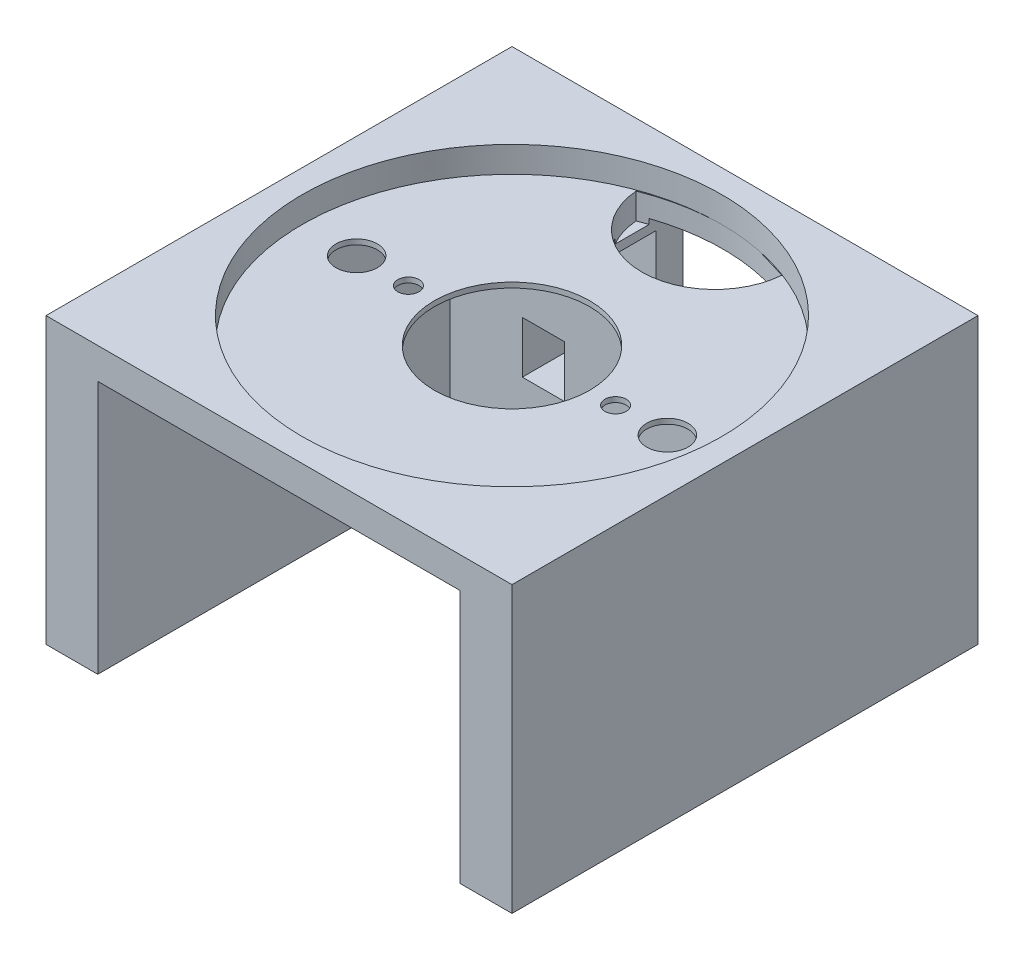
from build123d import *

# Parameters (mm, degrees)
BOSS_EXTRUDE1_DEPTH = 10
SKETCH2_R           = 40.5
CUT_EXTRUDE1_DEPTH  = 5
SKETCH4_R           = 2.05
CUT_EXTRUDE2_DEPTH  = 2
SKETCH5_R           = 15
CUT_EXTRUDE3_DEPTH  = 64.835726674
CUT_EXTRUDE4_DEPTH  = 66
SKETCH8_W           = 90
SKETCH8_H           = 90
BOSS_EXTRUDE2_DEPTH = 45
SKETCH9_W           = 70
SKETCH9_H           = 49
CUT_EXTRUDE5_DEPTH  = 68
CUT_EXTRUDE7_DEPTH  = 21
SKETCH12_W          = 0.314102564
SKETCH12_H          = 2.557692307
SKETCH12_H_2        = 3.589743589
SKETCH12_H_3        = 2.557692308
CUT_EXTRUDE9_DEPTH  = 4
CUT_EXTRUDE12_DEPTH = 3
CUT_EXTRUDE14_DEPTH = 9
SKETCH21_W          = 8.110410839
SKETCH21_H          = 10
CUT_EXTRUDE15_DEPTH = 9
SKETCH22_R          = 1.14
BOSS_EXTRUDE3_DEPTH = 9
SKETCH24_W          = 10.66
SKETCH24_H          = 20.6
SKETCH24_R          = 1.14
CUT_EXTRUDE16_DEPTH = 9
SKETCH25_W          = 8.11
SKETCH25_H          = 10
CUT_EXTRUDE17_DEPTH = 9
CUT_EXTRUDE20_DEPTH = 24.7
SKETCH31_R          = 4
CUT_EXTRUDE21_DEPTH = 10


with BuildPart() as part:
    # Sketch1 → Boss-Extrude1 (new body)
    with BuildSketch(Plane(origin=(0, 0, 0), x_dir=(1, 0, 0), z_dir=(0, 1, 0))):
        Polygon((0, -45), (-45, -45), (-45, 45), (0, 45), (45, 45), (45, -45), align=None)
    extrude(amount=BOSS_EXTRUDE1_DEPTH)

    # Sketch2 → Cut-Extrude1 (cut)
    with BuildSketch(Plane(origin=(0, 10, 0), x_dir=(1, 0, 0), z_dir=(0, 1, 0))):
        Circle(SKETCH2_R)
    extrude(amount=-CUT_EXTRUDE1_DEPTH, mode=Mode.SUBTRACT)

    # Sketch4 → Cut-Extrude2 (cut)
    with BuildSketch(Plane(origin=(0, 5, 0), x_dir=(1, 0, 0), z_dir=(0, 1, 0))):
        with Locations((-20, 0)):
            Circle(SKETCH4_R)
        with Locations((20, 0)):
            Circle(SKETCH4_R)
    extrude(amount=-CUT_EXTRUDE2_DEPTH, mode=Mode.SUBTRACT)

    # Sketch5 → Cut-Extrude3 (cut, through all)
    with BuildSketch(Plane(origin=(0, 5, 0), x_dir=(1, 0, 0), z_dir=(0, 1, 0))):
        Circle(SKETCH5_R)
    extrude(amount=-CUT_EXTRUDE3_DEPTH, mode=Mode.SUBTRACT)

    # Sketch7 → Cut-Extrude4 (cut)
    with BuildSketch(Plane(origin=(0, 5, 0), x_dir=(1, 0, 0), z_dir=(0, 1, 0))):
        with BuildLine():
            ThreePointArc((-13.841521615, 37.800491998), (0.234545088, 24.817118498), (14.31061179, 37.800491998))
            ThreePointArc((14.31061179, 37.800491998), (0.234545088, 40.503688372), (-13.841521615, 37.800491998))
        make_face()
    extrude(amount=-CUT_EXTRUDE4_DEPTH, mode=Mode.SUBTRACT)

    # Sketch8 → Boss-Extrude2 (add)
    with BuildSketch(Plane.XZ):
        Rectangle(SKETCH8_W, SKETCH8_H)
    extrude(amount=BOSS_EXTRUDE2_DEPTH)

    # Sketch9 → Cut-Extrude5 (cut)
    with BuildSketch(Plane.XY.offset(45)):
        with Locations((0, -20.5)):
            Rectangle(SKETCH9_W, SKETCH9_H)
    extrude(amount=-CUT_EXTRUDE5_DEPTH, mode=Mode.SUBTRACT)

    # Sketch10 → Cut-Extrude7 (cut)
    with BuildSketch(Plane(origin=(0, 0, -45), x_dir=(-1, 0, 0), z_dir=(0, 0, -1))):
        Polygon((-12, -21), (-12, -25), (-18, -25), (-18, -37), (18.337886809, -37), (18.337886809, -25), (12, -25), (12, 1), (-12, 1), (-12, -2), align=None)
    extrude(amount=-CUT_EXTRUDE7_DEPTH, mode=Mode.SUBTRACT)

    # Sketch12 → Cut-Extrude9 (cut)
    # profile 1 of 26: a face of its own
    with BuildSketch(Plane(origin=(0, 0, -45), x_dir=(-1, 0, 0), z_dir=(0, 0, -1))):
        with BuildLine():
            Line((-41.236340785, 0.241616987), (-40.549942548, 0.241616987))
            add(Edge.make_bspline(
                [(-40.549942548, 0.241616987), (-40.502731642, 0.24156509), (-40.412273449, 0.241465655), (-40.282558393, 0.238450909), (-40.164748661, 0.234424217), (-40.059098281, 0.228842324), (-39.965282182, 0.222245734), (-39.883724883, 0.212993694), (-39.813785327, 0.203333399), (-39.771878877, 0.193511992), (-39.752767067, 0.189032852)],
                knots=[0, 0, 0, 0, 1.415646017, 2.712440637, 3.8905458, 4.950247383, 5.884950622, 6.709939814, 7.411656543, 8, 8, 8, 8], degree=3))
            add(Edge.make_bspline(
                [(-39.752767067, 0.189032852), (-39.728573533, 0.182410902), (-39.680756556, 0.169323041), (-39.611855513, 0.143109317), (-39.546301667, 0.112027152), (-39.483870109, 0.076603212), (-39.425328026, 0.035317648), (-39.369801985, -0.01015597), (-39.317782005, -0.060867538), (-39.269560613, -0.116248278), (-39.225275815, -0.175368488), (-39.187146132, -0.239110718), (-39.155218905, -0.306402022), (-39.127835634, -0.377195593), (-39.108127179, -0.452085916), (-39.09328028, -0.530552629), (-39.083856652, -0.612587319), (-39.08295409, -0.668647186), (-39.082494631, -0.697185097)],
                knots=[0, 0, 0, 0, 0.999701418, 1.975846123, 2.934577507, 3.890451536, 4.834027766, 5.787354733, 6.749476667, 7.726910423, 8.712836071, 9.690891519, 10.682875813, 11.679750201, 12.712814741, 13.765529915, 14.8625177, 16, 16, 16, 16], degree=3))
            add(Edge.make_bspline(
                [(-39.082494631, -0.697185097), (-39.082916056, -0.725962873), (-39.083740602, -0.782268537), (-39.093636887, -0.864641326), (-39.106967079, -0.943359716), (-39.127464131, -1.018249166), (-39.154309804, -1.088864937), (-39.185801857, -1.156286169), (-39.223785387, -1.219365841), (-39.267430217, -1.278332958), (-39.315981811, -1.33324287), (-39.36923475, -1.383697665), (-39.426974042, -1.429402003), (-39.48901619, -1.470458347), (-39.555966039, -1.505914627), (-39.626808193, -1.537671931), (-39.702158409, -1.564342992), (-39.754300923, -1.578373054), (-39.780811939, -1.585506411)],
                knots=[0, 0, 0, 0, 1.121902311, 2.195077645, 3.232258892, 4.234102512, 5.217864754, 6.176164875, 7.132989551, 8.084763148, 9.034132444, 9.988522005, 10.94243251, 11.903244335, 12.886203696, 13.894208494, 14.929344452, 16, 16, 16, 16], degree=3))
            add(Edge.make_bspline(
                [(-39.780811939, -1.585506411), (-39.802739273, -1.590169392), (-39.8507943, -1.600388586), (-39.929937022, -1.611797043), (-40.022082408, -1.621534644), (-40.127104688, -1.628835781), (-40.244909593, -1.63508615), (-40.37556085, -1.640054243), (-40.519314928, -1.642784097), (-40.619586172, -1.64292489), (-40.67193774, -1.642998398)],
                knots=[0, 0, 0, 0, 0.601384939, 1.31797006, 2.144135048, 3.087295005, 4.142315834, 5.309527816, 6.595305764, 8, 8, 8, 8], degree=3))
            Line((-40.67193774, -1.642998398), (-40.922238221, -1.642998398))
            Line((-40.922238221, -1.642998398), (-40.922238221, -3.258383013))
            Line((-40.922238221, -3.258383013), (-41.236340785, -3.258383013))
            Line((-41.236340785, -3.258383013), (-41.236340785, 0.241616987))
        make_face()
        with BuildLine():
            Line((-40.922238221, -0.117357372), (-40.922238221, -1.284024039))
            Line((-40.922238221, -1.284024039), (-40.309457772, -1.291736379))
            add(Edge.make_bspline(
                [(-40.309457772, -1.291736379), (-40.279537846, -1.291751842), (-40.221778046, -1.291781694), (-40.138341823, -1.287796471), (-40.060932536, -1.283195938), (-39.98978796, -1.276460015), (-39.924876026, -1.266938757), (-39.866088497, -1.257327019), (-39.813881214, -1.243421657), (-39.752782012, -1.224698588), (-39.684698665, -1.192765972), (-39.610631116, -1.146416082), (-39.54786053, -1.087335374), (-39.493542233, -1.020907542), (-39.450436355, -0.947008413), (-39.418880363, -0.867939476), (-39.400339206, -0.784511627), (-39.397853012, -0.727423488), (-39.396597195, -0.69858734)],
                knots=[0, 0, 0, 0, 1.160613943, 2.240541288, 3.23993089, 4.169200891, 5.011653406, 5.7853311, 6.478053781, 7.106038997, 8.262395093, 9.384106736, 10.481365981, 11.59014053, 12.70357646, 13.786202915, 14.881775077, 16, 16, 16, 16], degree=3))
            add(Edge.make_bspline(
                [(-39.396597195, -0.69858734), (-39.397859842, -0.670448827), (-39.400369827, -0.614512945), (-39.41902569, -0.532534184), (-39.450375004, -0.45429848), (-39.493831598, -0.381325394), (-39.546572728, -0.31513659), (-39.607872071, -0.257639463), (-39.677585333, -0.211417761), (-39.742433564, -0.181584479), (-39.80003475, -0.163369203), (-39.85006671, -0.150624363), (-39.906557384, -0.140448757), (-39.969525164, -0.132209254), (-40.038481997, -0.125155793), (-40.114020312, -0.120369815), (-40.195853956, -0.117568359), (-40.252664526, -0.117429404), (-40.282114022, -0.117357372)],
                knots=[0, 0, 0, 0, 1.120700087, 2.227813068, 3.331159281, 4.466773991, 5.599788987, 6.693661531, 7.80175334, 8.91857717, 9.525282508, 10.207424825, 10.974604443, 11.810962634, 12.737642355, 13.736264703, 14.826523623, 16, 16, 16, 16], degree=3))
            Line((-40.282114022, -0.117357372), (-40.922238221, -0.117357372))
        make_face(mode=Mode.SUBTRACT)
    # profile 2 of 26: a face of its own
    with BuildSketch(Plane(origin=(0, 0, -45), x_dir=(-1, 0, 0), z_dir=(0, 0, -1))):
        with BuildLine():
            Line((-38.544033093, -0.700690706), (-38.229930529, -0.700690706))
            Line((-38.229930529, -0.700690706), (-38.229930529, -1.077193109))
            add(Edge.make_bspline(
                [(-38.229930529, -1.077193109), (-38.20674177, -1.042137281), (-38.162393449, -0.975093282), (-38.08868052, -0.886423981), (-38.013177188, -0.813008934), (-37.935522001, -0.754505415), (-37.855143901, -0.710692297), (-37.773806949, -0.678599262), (-37.690231479, -0.659621946), (-37.634069555, -0.657088287), (-37.605932131, -0.655818911)],
                knots=[0, 0, 0, 0, 1.2804753, 2.448899062, 3.506932113, 4.484331642, 5.4025378, 6.288909075, 7.142734305, 8, 8, 8, 8], degree=3))
            add(Edge.make_bspline(
                [(-37.605932131, -0.655818911), (-37.584105805, -0.657009437), (-37.539196719, -0.659459023), (-37.47121413, -0.676669848), (-37.401170678, -0.70414787), (-37.35602829, -0.729988093), (-37.332494631, -0.743459135)],
                knots=[0, 0, 0, 0, 0.901110191, 1.854092781, 2.881294221, 4, 4, 4, 4], degree=3))
            Line((-37.332494631, -0.743459135), (-37.504970593, -1.015494392))
            add(Edge.make_bspline(
                [(-37.504970593, -1.015494392), (-37.520079614, -1.008754125), (-37.548759428, -0.99595981), (-37.590713995, -0.9808178), (-37.629395331, -0.971901884), (-37.65403889, -0.970551167), (-37.665527484, -0.969921475)],
                knots=[0, 0, 0, 0, 1.180555205, 2.24091978, 3.179933427, 4, 4, 4, 4], degree=3))
            add(Edge.make_bspline(
                [(-37.665527484, -0.969921475), (-37.690733217, -0.971601512), (-37.742145607, -0.975028301), (-37.817630107, -1.001967109), (-37.890877312, -1.045492349), (-37.949048974, -1.093763461), (-37.994091227, -1.140311259), (-38.026231453, -1.180959661), (-38.0557142, -1.226538293), (-38.08388442, -1.276267977), (-38.109550714, -1.330997823), (-38.133505384, -1.390181036), (-38.155164246, -1.453886165), (-38.167514491, -1.498268685), (-38.173840785, -1.521003206)],
                knots=[0, 0, 0, 0, 1.125678352, 2.296057538, 3.5422874, 4.923748041, 5.663163013, 6.437101912, 7.23742474, 8.08941207, 8.991984279, 9.93940061, 10.944477711, 12, 12, 12, 12], degree=3))
            add(Edge.make_bspline(
                [(-38.173840785, -1.521003206), (-38.178573178, -1.541280379), (-38.18905507, -1.586192778), (-38.199246608, -1.661541303), (-38.209316126, -1.750564961), (-38.216412744, -1.853511554), (-38.222990786, -1.970123998), (-38.226700869, -2.100579944), (-38.229804009, -2.245013295), (-38.229887076, -2.345987648), (-38.229930529, -2.398807693)],
                knots=[0, 0, 0, 0, 0.566838948, 1.255505196, 2.06880316, 3.007127437, 4.065329342, 5.249902469, 6.561414163, 8, 8, 8, 8], degree=3))
            Line((-38.229930529, -2.398807693), (-38.229930529, -3.258383013))
            Line((-38.229930529, -3.258383013), (-38.544033093, -3.258383013))
            Line((-38.544033093, -3.258383013), (-38.544033093, -0.700690706))
        make_face()
    # profile 3 of 26: a face of its own
    with BuildSketch(Plane(origin=(0, 0, -45), x_dir=(-1, 0, 0), z_dir=(0, 0, -1))):
        with BuildLine():
            add(Edge.make_bspline(
                [(-35.783015464, -0.655818911), (-35.735024192, -0.656840802), (-35.640925034, -0.658844481), (-35.503117148, -0.680259446), (-35.371572012, -0.713006811), (-35.24578582, -0.758278373), (-35.127369525, -0.818960323), (-35.01459828, -0.891369614), (-34.907781272, -0.977152208), (-34.843758242, -1.043510276), (-34.811260657, -1.077193109)],
                knots=[0, 0, 0, 0, 1.054011418, 2.066658804, 3.057071809, 4.030435133, 4.997543892, 5.974964718, 6.972108034, 8, 8, 8, 8], degree=3))
            add(Edge.make_bspline(
                [(-34.811260657, -1.077193109), (-34.783278703, -1.109407095), (-34.727856322, -1.173211637), (-34.656790604, -1.27666725), (-34.595569044, -1.383807351), (-34.546506083, -1.496054678), (-34.507821059, -1.612429349), (-34.480355363, -1.73333136), (-34.464018428, -1.858493707), (-34.461815461, -1.943497545), (-34.460699759, -1.986548077)],
                knots=[0, 0, 0, 0, 1.025258237, 2.030674902, 3.01204498, 3.988269485, 4.97094183, 5.956517959, 6.965070386, 8, 8, 8, 8], degree=3))
            add(Edge.make_bspline(
                [(-34.460699759, -1.986548077), (-34.461681097, -2.029848135), (-34.463620265, -2.115411068), (-34.481963881, -2.241430434), (-34.510494967, -2.363625257), (-34.551326805, -2.481483951), (-34.603684915, -2.595366778), (-34.667575602, -2.704776327), (-34.743447219, -2.809928461), (-34.829451216, -2.909930299), (-34.924503092, -3.002096514), (-35.027619241, -3.082424783), (-35.136773274, -3.151246308), (-35.253416628, -3.206682723), (-35.376484114, -3.250392424), (-35.506241183, -3.28109244), (-35.642486253, -3.299654124), (-35.735513474, -3.302037697), (-35.783015464, -3.303254808)],
                knots=[0, 0, 0, 0, 0.998656419, 1.973391657, 2.932242238, 3.890759089, 4.846373663, 5.82037756, 6.809684879, 7.83454468, 8.860553229, 9.859544525, 10.845671541, 11.83227036, 12.833544569, 13.85385346, 14.904124723, 16, 16, 16, 16], degree=3))
            add(Edge.make_bspline(
                [(-35.783015464, -3.303254808), (-35.830750184, -3.302033612), (-35.924241044, -3.299641837), (-36.060967026, -3.281164555), (-36.190956645, -3.250406572), (-36.314185243, -3.206539079), (-36.43133009, -3.151244536), (-36.541116587, -3.082632846), (-36.644316502, -3.002072691), (-36.739388487, -2.909936754), (-36.825387092, -2.809926798), (-36.901260101, -2.704776759), (-36.965150427, -2.595366666), (-37.017508631, -2.481483981), (-37.058340444, -2.363625249), (-37.086871536, -2.241430436), (-37.105215151, -2.115411068), (-37.107154319, -2.029848135), (-37.108135657, -1.986548077)],
                knots=[0, 0, 0, 0, 1.099876186, 2.154163076, 3.173186993, 4.173200201, 5.163417411, 6.152872554, 7.150605724, 8.17532212, 9.198891216, 10.186952605, 11.159729845, 12.11414092, 13.071450619, 14.029093627, 15.002601286, 16, 16, 16, 16], degree=3))
            add(Edge.make_bspline(
                [(-37.108135657, -1.986548077), (-37.107012346, -1.943731532), (-37.104788385, -1.858962129), (-37.088467876, -1.734035068), (-37.061109319, -1.613337679), (-37.022377923, -1.497412203), (-36.972862732, -1.385656767), (-36.912501444, -1.278251936), (-36.840710812, -1.175264136), (-36.78550886, -1.111542056), (-36.757574759, -1.079296475)],
                knots=[0, 0, 0, 0, 1.031353054, 2.041901799, 3.029428768, 4.008703097, 4.981709435, 5.96992636, 6.972712378, 8, 8, 8, 8], degree=3))
            add(Edge.make_bspline(
                [(-36.757574759, -1.079296475), (-36.725126168, -1.045321536), (-36.661310304, -0.978503839), (-36.553961577, -0.892971315), (-36.441467756, -0.819055241), (-36.321742829, -0.759579026), (-36.196059972, -0.712740508), (-36.063840729, -0.680174993), (-35.925565214, -0.658921638), (-35.831005592, -0.65686346), (-35.783015464, -0.655818911)],
                knots=[0, 0, 0, 0, 1.027980169, 2.021703884, 2.998553061, 3.971491411, 4.943284454, 5.930300938, 6.949603206, 8, 8, 8, 8], degree=3))
        make_face()
        with BuildLine():
            add(Edge.make_bspline(
                [(-35.784417708, -0.969921475), (-35.818355319, -0.970886067), (-35.885354448, -0.972790349), (-35.983974033, -0.987274254), (-36.078914187, -1.010221758), (-36.170355031, -1.042825814), (-36.257988203, -1.084924713), (-36.341897606, -1.136633073), (-36.422330046, -1.19726603), (-36.497712109, -1.266728701), (-36.566894421, -1.342607696), (-36.627372398, -1.423456055), (-36.678797504, -1.507962401), (-36.721637663, -1.596214612), (-36.753544851, -1.689107026), (-36.776717874, -1.785587657), (-36.791188114, -1.885853074), (-36.793074493, -1.954014092), (-36.794033093, -1.988651443)],
                knots=[0, 0, 0, 0, 1.021534396, 2.016698045, 2.994645724, 3.958388632, 4.93408049, 5.916473867, 6.921342795, 7.962252576, 8.998418191, 10.008913653, 10.997312074, 11.973003931, 12.956656626, 13.948281152, 14.957379055, 16, 16, 16, 16], degree=3))
            add(Edge.make_bspline(
                [(-36.794033093, -1.988651443), (-36.792426269, -2.03340347), (-36.789237025, -2.122227875), (-36.763301788, -2.253038998), (-36.719915508, -2.37862085), (-36.661328229, -2.498237236), (-36.58792201, -2.608909514), (-36.501434943, -2.707580999), (-36.402795243, -2.79276681), (-36.293178743, -2.863447656), (-36.174824425, -2.919607411), (-36.049568104, -2.959406387), (-35.91892741, -2.985278079), (-35.829646678, -2.987849554), (-35.784417708, -2.989152244)],
                knots=[0, 0, 0, 0, 1.016792936, 2.018143844, 3.017858371, 4.030088057, 5.03801393, 6.028138512, 7.003788237, 7.991172063, 8.984598303, 9.972568034, 10.972917682, 12, 12, 12, 12], degree=3))
            add(Edge.make_bspline(
                [(-35.784417708, -2.989152244), (-35.739191339, -2.987841964), (-35.649915743, -2.985255507), (-35.519456566, -2.959536687), (-35.394542594, -2.919433027), (-35.276311207, -2.863510817), (-35.166744603, -2.792498402), (-35.067395482, -2.708062025), (-34.981646871, -2.608648173), (-34.908313266, -2.498090645), (-34.848766523, -2.378806293), (-34.805583322, -2.25301582), (-34.779585736, -2.122233778), (-34.776404907, -2.033405448), (-34.774802323, -1.988651443)],
                knots=[0, 0, 0, 0, 1.02726834, 2.027799167, 3.010890988, 4.004497153, 4.992059811, 5.971914811, 6.958719428, 7.966827853, 8.981595046, 9.981490638, 10.983022906, 12, 12, 12, 12], degree=3))
            add(Edge.make_bspline(
                [(-34.774802323, -1.988651443), (-34.775760593, -1.954013885), (-34.777646323, -1.885852459), (-34.792121287, -1.785590006), (-34.815276827, -1.689098409), (-34.847248444, -1.596246406), (-34.889902458, -1.507733902), (-34.942319251, -1.423704175), (-35.002550276, -1.342327629), (-35.072567397, -1.266973988), (-35.147870775, -1.197238951), (-35.228335813, -1.136609562), (-35.312120792, -1.085151966), (-35.399499374, -1.042465726), (-35.490951942, -1.010518385), (-35.585759071, -0.987141754), (-35.683957881, -0.972851557), (-35.750716924, -0.970904416), (-35.784417708, -0.969921475)],
                knots=[0, 0, 0, 0, 1.042956736, 2.052379634, 3.044323526, 4.02829302, 5.004299113, 5.996692471, 7.007513377, 8.048758398, 9.090003419, 10.095195979, 11.07790575, 12.047570684, 13.018257071, 13.989683339, 14.985167495, 16, 16, 16, 16], degree=3))
        make_face(mode=Mode.SUBTRACT)
    # profile 4 of 26: a face of its own
    with BuildSketch(Plane(origin=(0, 0, -45), x_dir=(-1, 0, 0), z_dir=(0, 0, -1))):
        Polygon((-33.518392067, 0.331360576), (-33.204289503, 0.331360576), (-33.204289503, -0.700690706), (-32.755571554, -0.700690706), (-32.755571554, -1.01479327), (-33.204289503, -1.01479327), (-33.204289503, -3.258383013), (-33.518392067, -3.258383013), (-33.518392067, -1.01479327), (-33.967110016, -1.01479327), (-33.967110016, -0.700690706), (-33.518392067, -0.700690706), align=None)
    # profile 5 of 26: a face of its own
    with BuildSketch(Plane(origin=(0, 0, -45), x_dir=(-1, 0, 0), z_dir=(0, 0, -1))):
        with BuildLine():
            add(Edge.make_bspline(
                [(-30.981733413, -0.655818911), (-30.93374214, -0.656840802), (-30.839642983, -0.658844481), (-30.701835097, -0.680259446), (-30.570289961, -0.713006811), (-30.444503769, -0.758278373), (-30.326087473, -0.818960323), (-30.213316229, -0.891369614), (-30.10649922, -0.977152208), (-30.042476191, -1.043510276), (-30.009978605, -1.077193109)],
                knots=[0, 0, 0, 0, 1.054011418, 2.066658804, 3.057071809, 4.030435133, 4.997543892, 5.974964718, 6.972108034, 8, 8, 8, 8], degree=3))
            add(Edge.make_bspline(
                [(-30.009978605, -1.077193109), (-29.981996651, -1.109407095), (-29.926574271, -1.173211637), (-29.855508552, -1.27666725), (-29.794286992, -1.383807351), (-29.745224031, -1.496054678), (-29.706539008, -1.612429349), (-29.679073311, -1.73333136), (-29.662736376, -1.858493707), (-29.660533409, -1.943497545), (-29.659417708, -1.986548077)],
                knots=[0, 0, 0, 0, 1.025258237, 2.030674902, 3.01204498, 3.988269485, 4.97094183, 5.956517959, 6.965070386, 8, 8, 8, 8], degree=3))
            add(Edge.make_bspline(
                [(-29.659417708, -1.986548077), (-29.660399045, -2.029848135), (-29.662338214, -2.115411068), (-29.68068183, -2.241430434), (-29.709212916, -2.363625257), (-29.750044754, -2.481483951), (-29.802402863, -2.595366778), (-29.866293551, -2.704776327), (-29.942165168, -2.809928461), (-30.028169165, -2.909930299), (-30.123221041, -3.002096514), (-30.226337189, -3.082424783), (-30.335491223, -3.151246308), (-30.452134576, -3.206682723), (-30.575202063, -3.250392424), (-30.704959131, -3.28109244), (-30.841204202, -3.299654124), (-30.934231423, -3.302037697), (-30.981733413, -3.303254808)],
                knots=[0, 0, 0, 0, 0.998656419, 1.973391657, 2.932242238, 3.890759089, 4.846373663, 5.82037756, 6.809684879, 7.83454468, 8.860553229, 9.859544525, 10.845671541, 11.83227036, 12.833544569, 13.85385346, 14.904124723, 16, 16, 16, 16], degree=3))
            add(Edge.make_bspline(
                [(-30.981733413, -3.303254808), (-31.029468133, -3.302033612), (-31.122958992, -3.299641837), (-31.259684974, -3.281164555), (-31.389674593, -3.250406572), (-31.512903192, -3.206539079), (-31.630048039, -3.151244536), (-31.739834536, -3.082632846), (-31.843034451, -3.002072691), (-31.938106436, -2.909936754), (-32.024105041, -2.809926798), (-32.099978049, -2.704776759), (-32.163868375, -2.595366666), (-32.216226579, -2.481483981), (-32.257058392, -2.363625249), (-32.285589485, -2.241430436), (-32.303933099, -2.115411068), (-32.305872268, -2.029848135), (-32.306853605, -1.986548077)],
                knots=[0, 0, 0, 0, 1.099876186, 2.154163076, 3.173186993, 4.173200201, 5.163417411, 6.152872554, 7.150605724, 8.17532212, 9.198891216, 10.186952605, 11.159729845, 12.11414092, 13.071450619, 14.029093627, 15.002601286, 16, 16, 16, 16], degree=3))
            add(Edge.make_bspline(
                [(-32.306853605, -1.986548077), (-32.305730295, -1.943731532), (-32.303506334, -1.858962129), (-32.287185825, -1.734035068), (-32.259827268, -1.613337679), (-32.221095872, -1.497412203), (-32.171580681, -1.385656767), (-32.111219393, -1.278251936), (-32.03942876, -1.175264136), (-31.984226809, -1.111542056), (-31.956292708, -1.079296475)],
                knots=[0, 0, 0, 0, 1.031353054, 2.041901799, 3.029428768, 4.008703097, 4.981709435, 5.96992636, 6.972712378, 8, 8, 8, 8], degree=3))
            add(Edge.make_bspline(
                [(-31.956292708, -1.079296475), (-31.923844117, -1.045321536), (-31.860028253, -0.978503839), (-31.752679525, -0.892971315), (-31.640185704, -0.819055241), (-31.520460778, -0.759579026), (-31.39477792, -0.712740508), (-31.262558678, -0.680174993), (-31.124283162, -0.658921638), (-31.029723541, -0.65686346), (-30.981733413, -0.655818911)],
                knots=[0, 0, 0, 0, 1.027980169, 2.021703884, 2.998553061, 3.971491411, 4.943284454, 5.930300938, 6.949603206, 8, 8, 8, 8], degree=3))
        make_face()
        with BuildLine():
            add(Edge.make_bspline(
                [(-30.983135657, -0.969921475), (-31.017073268, -0.970886067), (-31.084072397, -0.972790349), (-31.182691981, -0.987274254), (-31.277632135, -1.010221758), (-31.36907298, -1.042825814), (-31.456706152, -1.084924713), (-31.540615554, -1.136633073), (-31.621047994, -1.19726603), (-31.696430058, -1.266728701), (-31.76561237, -1.342607696), (-31.826090346, -1.423456055), (-31.877515453, -1.507962401), (-31.920355612, -1.596214612), (-31.9522628, -1.689107026), (-31.975435822, -1.785587657), (-31.989906063, -1.885853074), (-31.991792441, -1.954014092), (-31.992751041, -1.988651443)],
                knots=[0, 0, 0, 0, 1.021534396, 2.016698045, 2.994645724, 3.958388632, 4.93408049, 5.916473867, 6.921342795, 7.962252576, 8.998418191, 10.008913653, 10.997312074, 11.973003931, 12.956656626, 13.948281152, 14.957379055, 16, 16, 16, 16], degree=3))
            add(Edge.make_bspline(
                [(-31.992751041, -1.988651443), (-31.991144218, -2.03340347), (-31.987954973, -2.122227875), (-31.962019737, -2.253038998), (-31.918633457, -2.37862085), (-31.860046177, -2.498237236), (-31.786639959, -2.608909514), (-31.700152892, -2.707580999), (-31.601513192, -2.79276681), (-31.491896691, -2.863447656), (-31.373542373, -2.919607411), (-31.248286052, -2.959406387), (-31.117645358, -2.985278079), (-31.028364627, -2.987849554), (-30.983135657, -2.989152244)],
                knots=[0, 0, 0, 0, 1.016792936, 2.018143844, 3.017858371, 4.030088057, 5.03801393, 6.028138512, 7.003788237, 7.991172063, 8.984598303, 9.972568034, 10.972917682, 12, 12, 12, 12], degree=3))
            add(Edge.make_bspline(
                [(-30.983135657, -2.989152244), (-30.937909288, -2.987841964), (-30.848633692, -2.985255507), (-30.718174515, -2.959536687), (-30.593260543, -2.919433027), (-30.475029156, -2.863510817), (-30.365462552, -2.792498402), (-30.266113431, -2.708062025), (-30.18036482, -2.608648173), (-30.107031215, -2.498090645), (-30.047484472, -2.378806293), (-30.00430127, -2.25301582), (-29.978303684, -2.122233778), (-29.975122856, -2.033405448), (-29.973520272, -1.988651443)],
                knots=[0, 0, 0, 0, 1.02726834, 2.027799167, 3.010890988, 4.004497153, 4.992059811, 5.971914811, 6.958719428, 7.966827853, 8.981595046, 9.981490638, 10.983022906, 12, 12, 12, 12], degree=3))
            add(Edge.make_bspline(
                [(-29.973520272, -1.988651443), (-29.974478542, -1.954013885), (-29.976364271, -1.885852459), (-29.990839236, -1.785590006), (-30.013994775, -1.689098409), (-30.045966393, -1.596246406), (-30.088620406, -1.507733902), (-30.1410372, -1.423704175), (-30.201268225, -1.342327629), (-30.271285346, -1.266973988), (-30.346588724, -1.197238951), (-30.427053762, -1.136609562), (-30.51083874, -1.085151966), (-30.598217323, -1.042465726), (-30.689669891, -1.010518385), (-30.78447702, -0.987141754), (-30.88267583, -0.972851557), (-30.949434873, -0.970904416), (-30.983135657, -0.969921475)],
                knots=[0, 0, 0, 0, 1.042956736, 2.052379634, 3.044323526, 4.02829302, 5.004299113, 5.996692471, 7.007513377, 8.048758398, 9.090003419, 10.095195979, 11.07790575, 12.047570684, 13.018257071, 13.989683339, 14.985167495, 16, 16, 16, 16], degree=3))
        make_face(mode=Mode.SUBTRACT)
    # profile 6 of 26: a face of its own
    with BuildSketch(Plane(origin=(0, 0, -45), x_dir=(-1, 0, 0), z_dir=(0, 0, -1))):
        with BuildLine():
            Line((-28.94146899, 0.241616987), (-28.255070753, 0.241616987))
            add(Edge.make_bspline(
                [(-28.255070753, 0.241616987), (-28.207859847, 0.24156509), (-28.117401654, 0.241465655), (-27.987686598, 0.238450909), (-27.869876867, 0.234424217), (-27.764226486, 0.228842324), (-27.670410388, 0.222245734), (-27.588853088, 0.212993694), (-27.518913532, 0.203333399), (-27.477007082, 0.193511992), (-27.457895272, 0.189032852)],
                knots=[0, 0, 0, 0, 1.415646017, 2.712440637, 3.8905458, 4.950247383, 5.884950622, 6.709939814, 7.411656543, 8, 8, 8, 8], degree=3))
            add(Edge.make_bspline(
                [(-27.457895272, 0.189032852), (-27.433701738, 0.182410902), (-27.385884761, 0.169323041), (-27.316983718, 0.143109317), (-27.251429873, 0.112027152), (-27.188998314, 0.076603212), (-27.130456231, 0.035317648), (-27.07493019, -0.01015597), (-27.02291021, -0.060867538), (-26.974688818, -0.116248278), (-26.93040402, -0.175368488), (-26.892274338, -0.239110718), (-26.860347111, -0.306402022), (-26.832963839, -0.377195593), (-26.813255385, -0.452085916), (-26.798408485, -0.530552629), (-26.788984857, -0.612587319), (-26.788082296, -0.668647186), (-26.787622836, -0.697185097)],
                knots=[0, 0, 0, 0, 0.999701418, 1.975846123, 2.934577507, 3.890451536, 4.834027766, 5.787354733, 6.749476667, 7.726910423, 8.712836071, 9.690891519, 10.682875813, 11.679750201, 12.712814741, 13.765529915, 14.8625177, 16, 16, 16, 16], degree=3))
            add(Edge.make_bspline(
                [(-26.787622836, -0.697185097), (-26.788044261, -0.725962873), (-26.788868807, -0.782268537), (-26.798765092, -0.864641326), (-26.812095284, -0.943359716), (-26.832592336, -1.018249166), (-26.859438009, -1.088864937), (-26.890930062, -1.156286169), (-26.928913593, -1.219365841), (-26.972558422, -1.278332958), (-27.021110017, -1.33324287), (-27.074362955, -1.383697665), (-27.132102247, -1.429402003), (-27.194144395, -1.470458347), (-27.261094244, -1.505914627), (-27.331936398, -1.537671931), (-27.407286614, -1.564342992), (-27.459429128, -1.578373054), (-27.485940144, -1.585506411)],
                knots=[0, 0, 0, 0, 1.121902311, 2.195077645, 3.232258892, 4.234102512, 5.217864754, 6.176164875, 7.132989551, 8.084763148, 9.034132444, 9.988522005, 10.94243251, 11.903244335, 12.886203696, 13.894208494, 14.929344452, 16, 16, 16, 16], degree=3))
            add(Edge.make_bspline(
                [(-27.485940144, -1.585506411), (-27.507867478, -1.590169392), (-27.555922505, -1.600388586), (-27.635065227, -1.611797043), (-27.727210613, -1.621534644), (-27.832232893, -1.628835781), (-27.950037798, -1.63508615), (-28.080689056, -1.640054243), (-28.224443133, -1.642784097), (-28.324714377, -1.64292489), (-28.377065945, -1.642998398)],
                knots=[0, 0, 0, 0, 0.601384939, 1.31797006, 2.144135048, 3.087295005, 4.142315834, 5.309527816, 6.595305764, 8, 8, 8, 8], degree=3))
            Line((-28.377065945, -1.642998398), (-28.627366426, -1.642998398))
            Line((-28.627366426, -1.642998398), (-28.627366426, -3.258383013))
            Line((-28.627366426, -3.258383013), (-28.94146899, -3.258383013))
            Line((-28.94146899, -3.258383013), (-28.94146899, 0.241616987))
        make_face()
        with BuildLine():
            Line((-28.627366426, -0.117357372), (-28.627366426, -1.284024039))
            Line((-28.627366426, -1.284024039), (-28.014585977, -1.291736379))
            add(Edge.make_bspline(
                [(-28.014585977, -1.291736379), (-27.984666051, -1.291751842), (-27.926906252, -1.291781694), (-27.843470028, -1.287796471), (-27.766060741, -1.283195938), (-27.694916166, -1.276460015), (-27.630004231, -1.266938757), (-27.571216702, -1.257327019), (-27.519009419, -1.243421657), (-27.457910218, -1.224698588), (-27.38982687, -1.192765972), (-27.315759322, -1.146416082), (-27.252988735, -1.087335374), (-27.198670438, -1.020907542), (-27.155564561, -0.947008413), (-27.124008568, -0.867939476), (-27.105467411, -0.784511627), (-27.102981217, -0.727423488), (-27.1017254, -0.69858734)],
                knots=[0, 0, 0, 0, 1.160613943, 2.240541288, 3.23993089, 4.169200891, 5.011653406, 5.7853311, 6.478053781, 7.106038997, 8.262395093, 9.384106736, 10.481365981, 11.59014053, 12.70357646, 13.786202915, 14.881775077, 16, 16, 16, 16], degree=3))
            add(Edge.make_bspline(
                [(-27.1017254, -0.69858734), (-27.102988047, -0.670448827), (-27.105498032, -0.614512945), (-27.124153895, -0.532534184), (-27.155503209, -0.45429848), (-27.198959803, -0.381325394), (-27.251700933, -0.31513659), (-27.313000276, -0.257639463), (-27.382713538, -0.211417761), (-27.447561769, -0.181584479), (-27.505162955, -0.163369203), (-27.555194915, -0.150624363), (-27.611685589, -0.140448757), (-27.674653369, -0.132209254), (-27.743610203, -0.125155793), (-27.819148517, -0.120369815), (-27.900982161, -0.117568359), (-27.957792732, -0.117429404), (-27.987242227, -0.117357372)],
                knots=[0, 0, 0, 0, 1.120700087, 2.227813068, 3.331159281, 4.466773991, 5.599788987, 6.693661531, 7.80175334, 8.91857717, 9.525282508, 10.207424825, 10.974604443, 11.810962634, 12.737642355, 13.736264703, 14.826523623, 16, 16, 16, 16], degree=3))
            Line((-27.987242227, -0.117357372), (-28.627366426, -0.117357372))
        make_face(mode=Mode.SUBTRACT)
    # profile 7 of 26: a face of its own
    with BuildSketch(Plane(origin=(0, 0, -45), x_dir=(-1, 0, 0), z_dir=(0, 0, -1))):
        with BuildLine():
            add(Edge.make_bspline(
                [(-26.048640464, 0.376232371), (-26.029149149, 0.375328219), (-25.990981409, 0.373557715), (-25.935788141, 0.358396238), (-25.885531129, 0.332696552), (-25.840953396, 0.298216871), (-25.802701509, 0.257667428), (-25.775920799, 0.21040646), (-25.758708403, 0.159347821), (-25.756629848, 0.123732732), (-25.755571554, 0.105599358)],
                knots=[0, 0, 0, 0, 1.055194115, 2.066272739, 3.074728998, 4.095836921, 5.109056067, 6.073838105, 7.019297344, 8, 8, 8, 8], degree=3))
            add(Edge.make_bspline(
                [(-25.755571554, 0.105599358), (-25.756653714, 0.087936705), (-25.758793016, 0.05301973), (-25.775907504, 0.002846258), (-25.802929742, -0.043758025), (-25.840928868, -0.084228735), (-25.885537629, -0.118689355), (-25.935786414, -0.144394094), (-25.990981863, -0.159554232), (-26.029149302, -0.16132492), (-26.048640464, -0.162229167)],
                knots=[0, 0, 0, 0, 0.96129708, 1.900370562, 2.859976407, 3.87933698, 4.906634145, 5.921202961, 6.938410037, 8, 8, 8, 8], degree=3))
            add(Edge.make_bspline(
                [(-26.048640464, -0.162229167), (-26.06790874, -0.161359447), (-26.10541192, -0.15966665), (-26.159778762, -0.144096632), (-26.209607252, -0.118680559), (-26.254271924, -0.084454374), (-26.291502117, -0.043509477), (-26.318600443, 0.002817817), (-26.335675405, 0.053026971), (-26.337820033, 0.087939138), (-26.338904888, 0.105599358)],
                knots=[0, 0, 0, 0, 1.054934014, 2.053291228, 3.073705704, 4.106921865, 5.123545215, 6.088680038, 7.033164197, 8, 8, 8, 8], degree=3))
            add(Edge.make_bspline(
                [(-26.338904888, 0.105599358), (-26.337843801, 0.123730208), (-26.33575976, 0.159340341), (-26.318587644, 0.210435374), (-26.291727836, 0.257416875), (-26.254247272, 0.298442375), (-26.209613812, 0.33268781), (-26.159777067, 0.358098791), (-26.105412368, 0.37367013), (-26.067908892, 0.375362745), (-26.048640464, 0.376232371)],
                knots=[0, 0, 0, 0, 0.98631895, 1.937192651, 2.907499808, 3.917963147, 4.944918757, 5.95915025, 6.951458133, 8, 8, 8, 8], degree=3))
        make_face()
    # profile 8 of 26: a face of its own
    with BuildSketch(Plane(origin=(0, 0, -45), x_dir=(-1, 0, 0), z_dir=(0, 0, -1))):
        with Locations((-26.047238221, -1.97953686)):
            Rectangle(SKETCH12_W, SKETCH12_H)
    # profile 9 of 26: a face of its own
    with BuildSketch(Plane(origin=(0, 0, -45), x_dir=(-1, 0, 0), z_dir=(0, 0, -1))):
        with Locations((-25.015186939, -1.463511218)):
            Rectangle(SKETCH12_W, SKETCH12_H_2)
    # profile 10 of 26: a face of its own
    with BuildSketch(Plane(origin=(0, 0, -45), x_dir=(-1, 0, 0), z_dir=(0, 0, -1))):
        with Locations((-24.028007452, -1.463511218)):
            Rectangle(SKETCH12_W, SKETCH12_H_2)
    # profile 11 of 26: a face of its own
    with BuildSketch(Plane(origin=(0, 0, -45), x_dir=(-1, 0, 0), z_dir=(0, 0, -1))):
        with BuildLine():
            Line((-41.236340785, -10.091716347), (-41.236340785, -6.591716347))
            Line((-41.236340785, -6.591716347), (-40.529610016, -6.591716347))
            add(Edge.make_bspline(
                [(-40.529610016, -6.591716347), (-40.468141028, -6.592158917), (-40.349383262, -6.59301396), (-40.177770815, -6.598435351), (-40.018987052, -6.608025817), (-39.873554193, -6.621995343), (-39.741072981, -6.639148376), (-39.621914373, -6.660648781), (-39.51546223, -6.686036951), (-39.44999279, -6.707682401), (-39.419033093, -6.71791827)],
                knots=[0, 0, 0, 0, 1.314313732, 2.53924729, 3.670748893, 4.714932338, 5.66265055, 6.526160246, 7.303039223, 8, 8, 8, 8], degree=3))
            add(Edge.make_bspline(
                [(-39.419033093, -6.71791827), (-39.378538353, -6.733348975), (-39.298467161, -6.763860469), (-39.184460038, -6.821416771), (-39.077134676, -6.886629873), (-38.975915531, -6.959585735), (-38.883114704, -7.042350084), (-38.795106808, -7.131407169), (-38.715492084, -7.22999551), (-38.642583788, -7.336070498), (-38.576848128, -7.44838255), (-38.51970897, -7.566717658), (-38.472254977, -7.690474867), (-38.43286175, -7.819310015), (-38.401815293, -7.953506392), (-38.380633361, -8.093220258), (-38.366662371, -8.237899448), (-38.36525832, -8.336073912), (-38.364545913, -8.38588702)],
                knots=[0, 0, 0, 0, 0.984719456, 1.947108742, 2.898477687, 3.838006223, 4.779231079, 5.722358779, 6.681677486, 7.655904652, 8.64651281, 9.637519902, 10.640069247, 11.656948941, 12.698408672, 13.768548281, 14.867775369, 16, 16, 16, 16], degree=3))
            add(Edge.make_bspline(
                [(-38.364545913, -8.38588702), (-38.365174881, -8.429148258), (-38.366414327, -8.514399047), (-38.377543643, -8.640039943), (-38.393719963, -8.761953514), (-38.418764161, -8.879559214), (-38.449166674, -8.993887432), (-38.488130825, -9.103719676), (-38.532766321, -9.210063486), (-38.5848162, -9.311480962), (-38.641957585, -9.407564334), (-38.703279328, -9.498139862), (-38.768716024, -9.581915084), (-38.838891656, -9.659143696), (-38.912899373, -9.729709274), (-38.991223704, -9.79420129), (-39.074066754, -9.851357845), (-39.161057477, -9.903424953), (-39.254733606, -9.948845308), (-39.356869472, -9.987275318), (-39.46790065, -10.019121933), (-39.587554607, -10.045692829), (-39.716038085, -10.066770132), (-39.853477051, -10.080896524), (-39.999660341, -10.090449457), (-40.100039606, -10.09128585), (-40.151705368, -10.091716347)],
                knots=[0, 0, 0, 0, 1.105936401, 2.179363191, 3.223086493, 4.248585256, 5.251745608, 6.245858792, 7.225916811, 8.198733463, 9.158002045, 10.082870192, 10.993790845, 11.873723703, 12.748670949, 13.606408763, 14.465103618, 15.319838547, 16.196477973, 17.123216899, 18.106603292, 19.147568657, 20.255746949, 21.433717677, 22.679120308, 24, 24, 24, 24], degree=3))
            Line((-40.151705368, -10.091716347), (-41.236340785, -10.091716347))
        make_face()
        with BuildLine():
            Line((-40.922238221, -9.732741988), (-40.520495432, -9.732741988))
            add(Edge.make_bspline(
                [(-40.520495432, -9.732741988), (-40.462767062, -9.732493891), (-40.351734263, -9.732016711), (-40.192076266, -9.727829508), (-40.046196869, -9.72098757), (-39.91407536, -9.711412493), (-39.795786336, -9.698743877), (-39.691082586, -9.684618975), (-39.600307328, -9.667021524), (-39.545377891, -9.651070565), (-39.519994631, -9.64369952)],
                knots=[0, 0, 0, 0, 1.375205317, 2.645023457, 3.804390687, 4.853969522, 5.800190428, 6.637939096, 7.370582563, 8, 8, 8, 8], degree=3))
            add(Edge.make_bspline(
                [(-39.519994631, -9.64369952), (-39.488046269, -9.632447961), (-39.424912631, -9.610213588), (-39.334031546, -9.569655927), (-39.249274541, -9.521613857), (-39.169164516, -9.468211583), (-39.09483786, -9.407565581), (-39.025413744, -9.340994593), (-38.961031943, -9.268159817), (-38.902357635, -9.189151656), (-38.849849331, -9.10446186), (-38.804378101, -9.014923027), (-38.76452657, -8.921516216), (-38.733247977, -8.822807058), (-38.708732393, -8.719677999), (-38.691367705, -8.612121786), (-38.68055298, -8.500158504), (-38.679291532, -8.42400638), (-38.678648477, -8.385185898)],
                knots=[0, 0, 0, 0, 0.998632004, 1.973411704, 2.929992603, 3.868527914, 4.809262121, 5.754881198, 6.702106254, 7.672490631, 8.653608572, 9.636854334, 10.631411391, 11.644891563, 12.686317036, 13.754757253, 14.855430412, 16, 16, 16, 16], degree=3))
            add(Edge.make_bspline(
                [(-38.678648477, -8.385185898), (-38.679161765, -8.344252418), (-38.680170122, -8.263838233), (-38.692844433, -8.145847538), (-38.711365988, -8.032366887), (-38.738149674, -7.923388692), (-38.772280553, -7.81870034), (-38.814875195, -7.71888083), (-38.863541814, -7.622875961), (-38.921445151, -7.532901595), (-38.984860744, -7.447808486), (-39.055238624, -7.36985357), (-39.131460662, -7.29885927), (-39.212695512, -7.233719957), (-39.301232611, -7.177056282), (-39.394986302, -7.1263696), (-39.495331973, -7.083353709), (-39.565144669, -7.060474846), (-39.600623638, -7.048847757)],
                knots=[0, 0, 0, 0, 1.122418816, 2.205001699, 3.251619955, 4.274784885, 5.280384055, 6.268708349, 7.249350384, 8.229342522, 9.199999885, 10.157847722, 11.105861043, 12.055065948, 13.010012805, 13.98527497, 14.976112212, 16, 16, 16, 16], degree=3))
            add(Edge.make_bspline(
                [(-39.600623638, -7.048847757), (-39.629974784, -7.040731329), (-39.692383374, -7.023473576), (-39.794222838, -7.004648204), (-39.908837988, -6.988043705), (-40.036737689, -6.973985666), (-40.177776148, -6.963898344), (-40.332061836, -6.95632703), (-40.49966144, -6.951220397), (-40.615843974, -6.95087169), (-40.676144471, -6.950690706)],
                knots=[0, 0, 0, 0, 0.674548936, 1.434276114, 2.292660221, 3.240891867, 4.284742987, 5.42552168, 6.663806718, 8, 8, 8, 8], degree=3))
            Line((-40.676144471, -6.950690706), (-40.922238221, -6.950690706))
            Line((-40.922238221, -6.950690706), (-40.922238221, -9.732741988))
        make_face(mode=Mode.SUBTRACT)
    # profile 12 of 26: a face of its own
    with BuildSketch(Plane(origin=(0, 0, -45), x_dir=(-1, 0, 0), z_dir=(0, 0, -1))):
        with BuildLine():
            add(Edge.make_bspline(
                [(-37.625563541, -6.457100962), (-37.606072226, -6.458005114), (-37.567904486, -6.459775618), (-37.512711218, -6.474937096), (-37.462454206, -6.500636781), (-37.417876473, -6.535116462), (-37.379624586, -6.575665905), (-37.352843876, -6.622926874), (-37.33563148, -6.673985512), (-37.333552925, -6.709600602), (-37.332494631, -6.727733975)],
                knots=[0, 0, 0, 0, 1.055194115, 2.066272739, 3.074728998, 4.095836921, 5.109056067, 6.073838105, 7.019297344, 8, 8, 8, 8], degree=3))
            add(Edge.make_bspline(
                [(-37.332494631, -6.727733975), (-37.333576791, -6.745396628), (-37.335716093, -6.780313603), (-37.352830581, -6.830487075), (-37.379852819, -6.877091359), (-37.417851945, -6.917562069), (-37.462460706, -6.952022689), (-37.512709491, -6.977727428), (-37.56790494, -6.992887565), (-37.606072379, -6.994658254), (-37.625563541, -6.995562501)],
                knots=[0, 0, 0, 0, 0.96129708, 1.900370562, 2.859976407, 3.87933698, 4.906634145, 5.921202961, 6.938410037, 8, 8, 8, 8], degree=3))
            add(Edge.make_bspline(
                [(-37.625563541, -6.995562501), (-37.644831817, -6.99469278), (-37.682334997, -6.992999984), (-37.736701839, -6.977429966), (-37.786530328, -6.952013893), (-37.831195001, -6.917787708), (-37.868425194, -6.87684281), (-37.89552352, -6.830515516), (-37.912598482, -6.780306362), (-37.91474311, -6.745394196), (-37.915827964, -6.727733975)],
                knots=[0, 0, 0, 0, 1.054934014, 2.053291228, 3.073705704, 4.106921865, 5.123545215, 6.088680038, 7.033164197, 8, 8, 8, 8], degree=3))
            add(Edge.make_bspline(
                [(-37.915827964, -6.727733975), (-37.914766878, -6.709603125), (-37.912682837, -6.673992993), (-37.895510721, -6.62289796), (-37.868650913, -6.575916458), (-37.831170349, -6.534890959), (-37.786536889, -6.500645524), (-37.736700144, -6.475234542), (-37.682335445, -6.459663203), (-37.644831969, -6.457970589), (-37.625563541, -6.457100962)],
                knots=[0, 0, 0, 0, 0.98631895, 1.937192651, 2.907499808, 3.917963147, 4.944918757, 5.95915025, 6.951458133, 8, 8, 8, 8], degree=3))
        make_face()
    # profile 13 of 26: a face of its own
    with BuildSketch(Plane(origin=(0, 0, -45), x_dir=(-1, 0, 0), z_dir=(0, 0, -1))):
        with Locations((-37.624161298, -8.812870193)):
            Rectangle(SKETCH12_W, SKETCH12_H_3)
    # profile 14 of 26: a face of its own
    with BuildSketch(Plane(origin=(0, 0, -45), x_dir=(-1, 0, 0), z_dir=(0, 0, -1))):
        with BuildLine():
            Line((-35.492751041, -7.853034456), (-35.705892067, -8.072485577))
            add(Edge.make_bspline(
                [(-35.705892067, -8.072485577), (-35.724282571, -8.051172431), (-35.759737296, -8.010083194), (-35.815968777, -7.955146128), (-35.871992381, -7.909009189), (-35.927041194, -7.87005693), (-35.982499464, -7.840607783), (-36.037716382, -7.819112921), (-36.09274912, -7.805811115), (-36.129535155, -7.804096677), (-36.147598798, -7.803254808)],
                knots=[0, 0, 0, 0, 1.26578478, 2.440284043, 3.530471711, 4.527705817, 5.468200915, 6.346673037, 7.188140097, 8, 8, 8, 8], degree=3))
            add(Edge.make_bspline(
                [(-36.147598798, -7.803254808), (-36.169738188, -7.804329681), (-36.213305374, -7.806444879), (-36.275731192, -7.827558309), (-36.333681817, -7.859967048), (-36.383838797, -7.905935631), (-36.426326477, -7.9586999), (-36.457340158, -8.017696225), (-36.476306142, -8.081144269), (-36.478710874, -8.125174127), (-36.479930529, -8.147505609)],
                knots=[0, 0, 0, 0, 0.99966794, 1.967205029, 2.953328237, 3.988086729, 5.028030931, 6.008226631, 6.989793394, 8, 8, 8, 8], degree=3))
            add(Edge.make_bspline(
                [(-36.479930529, -8.147505609), (-36.478819716, -8.167717654), (-36.476601223, -8.208084764), (-36.459354544, -8.267632798), (-36.431888472, -8.325689836), (-36.406218277, -8.361252743), (-36.392991426, -8.379576924)],
                knots=[0, 0, 0, 0, 0.960159726, 1.917612774, 2.927026955, 4, 4, 4, 4], degree=3))
            add(Edge.make_bspline(
                [(-36.392991426, -8.379576924), (-36.385027932, -8.389361508), (-36.368078639, -8.410186762), (-36.336270124, -8.439090616), (-36.300247622, -8.471032867), (-36.256927684, -8.502969704), (-36.208176656, -8.536601429), (-36.152937372, -8.570603562), (-36.092962867, -8.607567987), (-36.05002556, -8.631012422), (-36.027706971, -8.643198718)],
                knots=[0, 0, 0, 0, 0.66740084, 1.420478572, 2.27185888, 3.217733974, 4.268547843, 5.408967954, 6.65319498, 8, 8, 8, 8], degree=3))
            add(Edge.make_bspline(
                [(-36.027706971, -8.643198718), (-36.000493394, -8.658443621), (-35.947925724, -8.687891754), (-35.873232956, -8.733601457), (-35.805445915, -8.779032881), (-35.743990248, -8.823700155), (-35.690048439, -8.868853023), (-35.641983886, -8.91276078), (-35.600995442, -8.956750088), (-35.578041516, -8.987483202), (-35.567069952, -9.002173077)],
                knots=[0, 0, 0, 0, 1.27191281, 2.456916733, 3.569705269, 4.599008579, 5.553216877, 6.436649441, 7.252746552, 8, 8, 8, 8], degree=3))
            add(Edge.make_bspline(
                [(-35.567069952, -9.002173077), (-35.548859424, -9.031839165), (-35.512617095, -9.090880187), (-35.474558828, -9.188098614), (-35.452498554, -9.291209116), (-35.449436333, -9.361741337), (-35.447879246, -9.39760577)],
                knots=[0, 0, 0, 0, 0.995354457, 1.980940102, 2.973342416, 4, 4, 4, 4], degree=3))
            add(Edge.make_bspline(
                [(-35.447879246, -9.39760577), (-35.44859878, -9.422874916), (-35.4500167, -9.472670529), (-35.459874767, -9.546005359), (-35.476829744, -9.616139916), (-35.499923498, -9.683835201), (-35.53110787, -9.747794141), (-35.567655668, -9.80963039), (-35.611530579, -9.86800632), (-35.661621955, -9.922845281), (-35.716467449, -9.972931028), (-35.774973587, -10.016954982), (-35.837212418, -10.053529319), (-35.902739219, -10.083794664), (-35.971702873, -10.107862922), (-36.044114163, -10.124525454), (-36.119742917, -10.134498215), (-36.171172725, -10.135882691), (-36.197378445, -10.136588142)],
                knots=[0, 0, 0, 0, 1.032770009, 2.035186124, 3.017557409, 3.978232242, 4.952395191, 5.920591857, 6.910227898, 7.931268572, 8.952309245, 9.941945286, 10.918353717, 11.897095711, 12.887975737, 13.898235213, 14.929059601, 16, 16, 16, 16], degree=3))
            add(Edge.make_bspline(
                [(-36.197378445, -10.136588142), (-36.232745621, -10.135595441), (-36.302988548, -10.133623834), (-36.406878267, -10.115117773), (-36.508399025, -10.086322379), (-36.606782566, -10.046606445), (-36.69982868, -9.996455732), (-36.784959604, -9.936393338), (-36.862471067, -9.868403341), (-36.90658934, -9.81629043), (-36.928648477, -9.790233975)],
                knots=[0, 0, 0, 0, 1.013940152, 2.01379169, 3.017749504, 4.037548394, 5.051665909, 6.043208538, 7.021604269, 8, 8, 8, 8], degree=3))
            Line((-36.928648477, -9.790233975), (-36.720415304, -9.553254808))
            add(Edge.make_bspline(
                [(-36.720415304, -9.553254808), (-36.700642891, -9.574609573), (-36.662311079, -9.616009013), (-36.601009862, -9.671133353), (-36.538630461, -9.717334624), (-36.475795775, -9.755978039), (-36.41157568, -9.785753442), (-36.346330066, -9.806672036), (-36.280191642, -9.820116229), (-36.235769506, -9.821694511), (-36.213504246, -9.822485577)],
                knots=[0, 0, 0, 0, 1.179806542, 2.287233372, 3.337373186, 4.324005949, 5.273901747, 6.200048787, 7.097828587, 8, 8, 8, 8], degree=3))
            add(Edge.make_bspline(
                [(-36.213504246, -9.822485577), (-36.183186321, -9.821114753), (-36.123950179, -9.818436391), (-36.03910642, -9.794119299), (-35.960767794, -9.755989347), (-35.892744448, -9.701904649), (-35.834842287, -9.638949076), (-35.792914113, -9.568034957), (-35.766637937, -9.4912435), (-35.763551939, -9.438011198), (-35.761981811, -9.410927084)],
                knots=[0, 0, 0, 0, 1.072336372, 2.095165389, 3.102688358, 4.141489647, 5.156069229, 6.117746104, 7.042326257, 8, 8, 8, 8], degree=3))
            add(Edge.make_bspline(
                [(-35.761981811, -9.410927084), (-35.763068105, -9.388617465), (-35.765212848, -9.34457011), (-35.78205612, -9.280819768), (-35.808668972, -9.220350488), (-35.83487362, -9.184960841), (-35.848219791, -9.166936699)],
                knots=[0, 0, 0, 0, 1.013901739, 2.00181326, 2.98231254, 4, 4, 4, 4], degree=3))
            add(Edge.make_bspline(
                [(-35.848219791, -9.166936699), (-35.856242186, -9.157901337), (-35.873717858, -9.138219055), (-35.9057731, -9.109793976), (-35.944154962, -9.079155877), (-35.989295125, -9.046824288), (-36.041284587, -9.013225683), (-36.100334062, -8.978536331), (-36.165634615, -8.941108605), (-36.211805246, -8.916288949), (-36.235940144, -8.903314904)],
                knots=[0, 0, 0, 0, 0.615000592, 1.339693406, 2.178160186, 3.116406724, 4.166410947, 5.330106347, 6.604359322, 8, 8, 8, 8], degree=3))
            add(Edge.make_bspline(
                [(-36.235940144, -8.903314904), (-36.261986784, -8.888775773), (-36.312499531, -8.860579756), (-36.384046822, -8.816663676), (-36.448594177, -8.771996401), (-36.507694751, -8.729083562), (-36.559855757, -8.685662618), (-36.604871705, -8.641685367), (-36.644514921, -8.598925381), (-36.666462333, -8.568628084), (-36.676945753, -8.554156251)],
                knots=[0, 0, 0, 0, 1.262093308, 2.447601706, 3.550203992, 4.582594899, 5.537233252, 6.418365656, 7.244515135, 8, 8, 8, 8], degree=3))
            add(Edge.make_bspline(
                [(-36.676945753, -8.554156251), (-36.695076353, -8.525010635), (-36.731343888, -8.46670922), (-36.766559079, -8.369398743), (-36.790765108, -8.266953686), (-36.792927498, -8.196266832), (-36.794033093, -8.160125802)],
                knots=[0, 0, 0, 0, 0.985009483, 1.970363186, 2.962279964, 4, 4, 4, 4], degree=3))
            add(Edge.make_bspline(
                [(-36.794033093, -8.160125802), (-36.793498897, -8.136500404), (-36.792453401, -8.090262153), (-36.78410935, -8.022323333), (-36.768917639, -7.957775179), (-36.749862716, -7.895648316), (-36.723379712, -7.837146222), (-36.691733806, -7.781488751), (-36.654546382, -7.728752833), (-36.611703091, -7.679749701), (-36.564596445, -7.635240374), (-36.513701676, -7.596441746), (-36.460163419, -7.563335391), (-36.403755, -7.535570231), (-36.343934527, -7.514568848), (-36.28112014, -7.500111463), (-36.215438985, -7.49045626), (-36.170537859, -7.489593176), (-36.147598798, -7.489152244)],
                knots=[0, 0, 0, 0, 1.087655834, 2.128696564, 3.144119009, 4.137814668, 5.115653402, 6.093965665, 7.082169637, 8.081268856, 9.086088321, 10.061021666, 11.022561449, 11.980240094, 12.950172527, 13.934149372, 14.944599409, 16, 16, 16, 16], degree=3))
            add(Edge.make_bspline(
                [(-36.147598798, -7.489152244), (-36.120406734, -7.490256585), (-36.065512513, -7.492485982), (-35.983157886, -7.510191673), (-35.900924544, -7.539324777), (-35.818601194, -7.579561011), (-35.736790905, -7.631627886), (-35.654774048, -7.694557186), (-35.571566018, -7.7679349), (-35.519609705, -7.824034126), (-35.492751041, -7.853034456)],
                knots=[0, 0, 0, 0, 0.845714091, 1.707292901, 2.609013841, 3.555613372, 4.552488639, 5.621697636, 6.770543573, 8, 8, 8, 8], degree=3))
        make_face()
    # profile 15 of 26: a face of its own
    with BuildSketch(Plane(origin=(0, 0, -45), x_dir=(-1, 0, 0), z_dir=(0, 0, -1))):
        with BuildLine():
            Line((-34.819674118, -7.534024039), (-34.505571554, -7.534024039))
            Line((-34.505571554, -7.534024039), (-34.505571554, -8.007281251))
            add(Edge.make_bspline(
                [(-34.505571554, -8.007281251), (-34.47221407, -7.964343517), (-34.407390475, -7.880902624), (-34.295665571, -7.772912495), (-34.177738762, -7.681837192), (-34.050575349, -7.610454659), (-33.916151659, -7.556633847), (-33.775019342, -7.516854397), (-33.625980577, -7.493412922), (-33.524084124, -7.490591261), (-33.472118029, -7.489152244)],
                knots=[0, 0, 0, 0, 1.0828784, 2.104357462, 3.088488658, 4.04616522, 5.001424249, 5.969181776, 6.964304535, 8, 8, 8, 8], degree=3))
            add(Edge.make_bspline(
                [(-33.472118029, -7.489152244), (-33.426726425, -7.490465423), (-33.337007537, -7.49306099), (-33.204944308, -7.510634045), (-33.077768925, -7.540751737), (-32.956200871, -7.584152652), (-32.838937805, -7.637808122), (-32.727715706, -7.705525158), (-32.62080215, -7.783931349), (-32.520885961, -7.8741635), (-32.428564593, -7.971791766), (-32.348718412, -8.07681407), (-32.279846508, -8.185776656), (-32.224176211, -8.300368749), (-32.180567864, -8.419687979), (-32.149553186, -8.544216419), (-32.131095543, -8.67349236), (-32.128619091, -8.76139508), (-32.127366426, -8.805858975)],
                knots=[0, 0, 0, 0, 1.041296284, 2.058176809, 3.050446431, 4.034000596, 5.01514041, 6.003636468, 7.015969324, 8.052561599, 9.08815499, 10.094063707, 11.074456064, 12.040834395, 13.011057502, 13.983766392, 14.980127149, 16, 16, 16, 16], degree=3))
            add(Edge.make_bspline(
                [(-32.127366426, -8.805858975), (-32.128591912, -8.851261283), (-32.131008746, -8.940801188), (-32.149753752, -9.072288285), (-32.179710626, -9.198775659), (-32.222768809, -9.320052923), (-32.278410297, -9.436036574), (-32.346114858, -9.54664297), (-32.426001325, -9.651836673), (-32.517302453, -9.750189573), (-32.616355389, -9.840788886), (-32.722232878, -9.920026956), (-32.833291804, -9.986568331), (-32.948963971, -10.042151291), (-33.070239609, -10.084043475), (-33.196552887, -10.114261275), (-33.327835034, -10.132895771), (-33.417136186, -10.135347913), (-33.462302323, -10.136588142)],
                knots=[0, 0, 0, 0, 1.038740735, 2.04854663, 3.033179607, 4.009277356, 4.987731542, 5.972001279, 6.972200261, 8.005528982, 9.039189865, 10.040446548, 11.026516639, 11.997840187, 12.972163198, 13.956796175, 14.96660207, 16, 16, 16, 16], degree=3))
            add(Edge.make_bspline(
                [(-33.462302323, -10.136588142), (-33.513129895, -10.135293334), (-33.613529251, -10.132735709), (-33.760326922, -10.106816299), (-33.901603774, -10.068079363), (-34.035794598, -10.01138037), (-34.163962411, -9.939124854), (-34.285382217, -9.851014648), (-34.40069897, -9.747234023), (-34.470107727, -9.668502207), (-34.505571554, -9.62827484)],
                knots=[0, 0, 0, 0, 1.014726462, 2.004382257, 2.969841629, 3.936926163, 4.907207904, 5.903978561, 6.929055279, 8, 8, 8, 8], degree=3))
            Line((-34.505571554, -9.62827484), (-34.505571554, -11.034024039))
            Line((-34.505571554, -11.034024039), (-34.819674118, -11.034024039))
            Line((-34.819674118, -11.034024039), (-34.819674118, -7.534024039))
        make_face()
        with BuildLine():
            add(Edge.make_bspline(
                [(-33.474922516, -7.803254808), (-33.510502078, -7.803895066), (-33.580549066, -7.80515557), (-33.683221285, -7.820129519), (-33.782116713, -7.84186726), (-33.876238664, -7.87477916), (-33.966489281, -7.915177973), (-34.052173445, -7.965659984), (-34.133231013, -8.02531199), (-34.209458043, -8.092991334), (-34.278321337, -8.167566022), (-34.339284265, -8.247153831), (-34.39049157, -8.331653971), (-34.43299359, -8.420279334), (-34.465336873, -8.513724619), (-34.488292593, -8.611457631), (-34.502722945, -8.713585344), (-34.504611883, -8.78314135), (-34.505571554, -8.818479167)],
                knots=[0, 0, 0, 0, 1.05670511, 2.080379991, 3.077984906, 4.06214886, 5.038337365, 6.01289324, 7.01187578, 8.025460281, 9.038092164, 10.024533457, 11.000252242, 11.969694649, 12.940728589, 13.933144304, 14.949937299, 16, 16, 16, 16], degree=3))
            add(Edge.make_bspline(
                [(-34.505571554, -8.818479167), (-34.503980698, -8.86486728), (-34.500864076, -8.955745521), (-34.475526708, -9.088529643), (-34.434291444, -9.214181298), (-34.375762731, -9.331642335), (-34.301815156, -9.43962517), (-34.212717, -9.536315777), (-34.109274449, -9.621106368), (-33.993207257, -9.692527622), (-33.868785127, -9.750515688), (-33.738999214, -9.792029898), (-33.605634334, -9.817602127), (-33.515466014, -9.820848946), (-33.470014663, -9.822485577)],
                knots=[0, 0, 0, 0, 1.03728447, 2.032128127, 3.01272805, 3.987917167, 4.958271349, 5.931593992, 6.91984656, 7.941419022, 8.973179163, 9.983609215, 10.983593296, 12, 12, 12, 12], degree=3))
            add(Edge.make_bspline(
                [(-33.470014663, -9.822485577), (-33.425478895, -9.820929201), (-33.337083402, -9.817840072), (-33.206925281, -9.791101885), (-33.080434642, -9.75025686), (-32.96025447, -9.690697304), (-32.847430982, -9.617707246), (-32.745549429, -9.530147212), (-32.656542515, -9.428657269), (-32.58067816, -9.315648766), (-32.519546675, -9.194473383), (-32.473616435, -9.069091994), (-32.447107861, -8.939946571), (-32.443351073, -8.852948858), (-32.44146899, -8.809364584)],
                knots=[0, 0, 0, 0, 1.00104056, 1.986885549, 2.97790532, 3.984399681, 4.995088187, 5.994304198, 6.996462723, 8.023150851, 9.048424203, 10.043036403, 11.019596776, 12, 12, 12, 12], degree=3))
            add(Edge.make_bspline(
                [(-32.44146899, -8.809364584), (-32.442923724, -8.765509595), (-32.445821858, -8.678141291), (-32.474368895, -8.549378388), (-32.517268873, -8.423490412), (-32.579827925, -8.303969862), (-32.654029195, -8.19119578), (-32.743776192, -8.091641901), (-32.844392388, -8.004471228), (-32.957081552, -7.932455818), (-33.078021977, -7.875170323), (-33.205336893, -7.833286684), (-33.338380496, -7.808112935), (-33.42900815, -7.804888428), (-33.474922516, -7.803254808)],
                knots=[0, 0, 0, 0, 0.983928682, 1.960191568, 2.949917689, 3.96440592, 4.982380491, 5.975291189, 6.965713506, 7.964880129, 8.970154049, 9.96478489, 10.968906225, 12, 12, 12, 12], degree=3))
        make_face(mode=Mode.SUBTRACT)
    # profile 16 of 26: a face of its own
    with BuildSketch(Plane(origin=(0, 0, -45), x_dir=(-1, 0, 0), z_dir=(0, 0, -1))):
        with BuildLine():
            Line((-29.400002644, -9.284024039), (-29.12095617, -9.430558494))
            add(Edge.make_bspline(
                [(-29.12095617, -9.430558494), (-29.143192765, -9.470001825), (-29.186456373, -9.546742928), (-29.260857121, -9.652174789), (-29.338849194, -9.747022504), (-29.423953162, -9.828752159), (-29.513622841, -9.900003544), (-29.608355496, -9.962341368), (-29.708644313, -10.015459889), (-29.814494038, -10.060212417), (-29.926793589, -10.094621911), (-30.045815106, -10.118926132), (-30.171786601, -10.1339494), (-30.258132781, -10.135694541), (-30.302346394, -10.136588142)],
                knots=[0, 0, 0, 0, 1.120438281, 2.179929193, 3.190490725, 4.156257408, 5.095198341, 6.022838206, 6.959905092, 7.901321166, 8.864066838, 9.862729781, 10.905609505, 12, 12, 12, 12], degree=3))
            add(Edge.make_bspline(
                [(-30.302346394, -10.136588142), (-30.351488371, -10.135440966), (-30.447350133, -10.133203159), (-30.58688988, -10.113910695), (-30.718269299, -10.082438336), (-30.841481002, -10.038472795), (-30.956223255, -9.981045471), (-31.062724109, -9.911085989), (-31.161543635, -9.828953734), (-31.249567844, -9.733937291), (-31.328811727, -9.632255333), (-31.398737547, -9.526299449), (-31.457194978, -9.416336225), (-31.504747588, -9.3030657), (-31.543152453, -9.187201807), (-31.569919157, -9.067690339), (-31.585348905, -8.944854755), (-31.587713351, -8.861757419), (-31.588904888, -8.819881411)],
                knots=[0, 0, 0, 0, 1.145258523, 2.234067595, 3.276747158, 4.290159414, 5.277019952, 6.260822364, 7.254936242, 8.264827045, 9.274100331, 10.257902744, 11.220704747, 12.172965371, 13.118907548, 14.062713208, 15.023725156, 16, 16, 16, 16], degree=3))
            add(Edge.make_bspline(
                [(-31.588904888, -8.819881411), (-31.587845746, -8.78058658), (-31.585746668, -8.702709416), (-31.572515881, -8.587443871), (-31.549067587, -8.475415419), (-31.516891264, -8.366530971), (-31.475340017, -8.260972837), (-31.424507798, -8.158676773), (-31.36431542, -8.059751633), (-31.317842747, -7.997348499), (-31.294433734, -7.965915065)],
                knots=[0, 0, 0, 0, 1.024358464, 2.0301432, 3.019427413, 4.004406732, 4.986367066, 5.972626655, 6.978780325, 8, 8, 8, 8], degree=3))
            add(Edge.make_bspline(
                [(-31.294433734, -7.965915065), (-31.262726051, -7.928046195), (-31.200315104, -7.853508044), (-31.094758749, -7.755569718), (-30.980458553, -7.673525943), (-30.858846926, -7.605518807), (-30.728510452, -7.55384516), (-30.591201161, -7.515337578), (-30.445355575, -7.493759567), (-30.345650354, -7.490711733), (-30.294634054, -7.489152244)],
                knots=[0, 0, 0, 0, 1.030682036, 2.02871468, 2.997146059, 3.962720338, 4.930598197, 5.918074684, 6.934738563, 8, 8, 8, 8], degree=3))
            add(Edge.make_bspline(
                [(-30.294634054, -7.489152244), (-30.242186449, -7.490506293), (-30.139296203, -7.493162628), (-29.989264082, -7.517788962), (-29.847303365, -7.556841516), (-29.713470861, -7.611995307), (-29.587753, -7.683154859), (-29.470966951, -7.7712967), (-29.361115438, -7.873714787), (-29.297206859, -7.952477997), (-29.264686138, -7.992557693)],
                knots=[0, 0, 0, 0, 1.056321875, 2.072262726, 3.055038591, 4.01806755, 4.982017516, 5.957941055, 6.960871419, 8, 8, 8, 8], degree=3))
            add(Edge.make_bspline(
                [(-29.264686138, -7.992557693), (-29.242559199, -8.022761274), (-29.198452606, -8.082967393), (-29.143205506, -8.18113855), (-29.095248111, -8.283849144), (-29.05691515, -8.392759441), (-29.025875649, -8.506579022), (-29.00341883, -8.626121566), (-28.990249212, -8.751351478), (-28.987660514, -8.836678033), (-28.986340785, -8.880177885)],
                knots=[0, 0, 0, 0, 0.94817472, 1.890038105, 2.849395472, 3.817997239, 4.812318967, 5.836947057, 6.897266129, 8, 8, 8, 8], degree=3))
            Line((-28.986340785, -8.880177885), (-31.274802323, -8.880177885))
            add(Edge.make_bspline(
                [(-31.274802323, -8.880177885), (-31.273262717, -8.913878349), (-31.270235143, -8.980148953), (-31.25612, -9.077119736), (-31.233871226, -9.169493078), (-31.202602163, -9.25657612), (-31.164735318, -9.339506248), (-31.118349601, -9.417668285), (-31.063010047, -9.490706215), (-31.001284348, -9.559273352), (-30.932577253, -9.620334114), (-30.860294506, -9.67498589), (-30.783400941, -9.720791487), (-30.702502857, -9.757971376), (-30.617731072, -9.787077692), (-30.529058877, -9.806945513), (-30.43666076, -9.82025262), (-30.373675026, -9.821732285), (-30.341609214, -9.822485577)],
                knots=[0, 0, 0, 0, 1.094153842, 2.151609401, 3.174256925, 4.172055639, 5.149267565, 6.128595816, 7.11444997, 8.118368179, 9.117203808, 10.09244225, 11.054858984, 12.015122123, 12.976791628, 13.957293641, 14.960065497, 16, 16, 16, 16], degree=3))
            add(Edge.make_bspline(
                [(-30.341609214, -9.822485577), (-30.310258067, -9.821877521), (-30.248051376, -9.82067102), (-30.155410519, -9.808939109), (-30.064270991, -9.789968833), (-29.975010008, -9.764078843), (-29.889439162, -9.732501991), (-29.810193612, -9.694399133), (-29.737313396, -9.652249387), (-29.66919643, -9.604039712), (-29.603125436, -9.545031525), (-29.53758295, -9.471395804), (-29.467306297, -9.384308276), (-29.423316704, -9.31876261), (-29.400002644, -9.284024039)],
                knots=[0, 0, 0, 0, 0.99110716, 1.966546729, 2.947904876, 3.932708344, 4.903319531, 5.828989031, 6.710028674, 7.56322171, 8.463672341, 9.504779593, 10.677557249, 12, 12, 12, 12], degree=3))
        make_face()
        with BuildLine():
            add(Edge.make_bspline(
                [(-29.300443349, -8.566075321), (-29.311939974, -8.524412447), (-29.334067275, -8.444224827), (-29.38030364, -8.333183936), (-29.43237518, -8.234496035), (-29.493996912, -8.148916402), (-29.563815637, -8.072912889), (-29.64446082, -8.006494304), (-29.734896713, -7.947076853), (-29.834655854, -7.896924354), (-29.940297639, -7.854234495), (-30.050903831, -7.825609379), (-30.163761619, -7.805999837), (-30.240095905, -7.804173728), (-30.278508253, -7.803254808)],
                knots=[0, 0, 0, 0, 1.154881502, 2.222775134, 3.210006277, 4.132804581, 5.035138423, 5.962687519, 6.919655026, 7.923214229, 8.944639381, 9.960483929, 10.97369054, 12, 12, 12, 12], degree=3))
            add(Edge.make_bspline(
                [(-30.278508253, -7.803254808), (-30.309857691, -7.80386648), (-30.37182894, -7.805075626), (-30.463130009, -7.816545755), (-30.550809708, -7.8355056), (-30.635514995, -7.861470557), (-30.716135864, -7.896079159), (-30.794330632, -7.936662386), (-30.868111028, -7.98620397), (-30.914252324, -8.023962824), (-30.93756274, -8.043038462)],
                knots=[0, 0, 0, 0, 1.04873581, 2.073130211, 3.073294108, 4.04793562, 5.032784715, 6.005352987, 6.992311501, 8, 8, 8, 8], degree=3))
            add(Edge.make_bspline(
                [(-30.93756274, -8.043038462), (-30.954256022, -8.058132778), (-30.988039156, -8.088679994), (-31.033179678, -8.1413092), (-31.07640015, -8.198060762), (-31.115733803, -8.261105887), (-31.15181139, -8.329726666), (-31.185571367, -8.403344301), (-31.215957779, -8.482517432), (-31.233053889, -8.537689871), (-31.241849599, -8.566075321)],
                knots=[0, 0, 0, 0, 0.879870761, 1.780643979, 2.707998968, 3.669668524, 4.684282772, 5.740141944, 6.837334558, 8, 8, 8, 8], degree=3))
            Line((-31.241849599, -8.566075321), (-29.300443349, -8.566075321))
        make_face(mode=Mode.SUBTRACT)
    # profile 17 of 26: a face of its own
    with BuildSketch(Plane(origin=(0, 0, -45), x_dir=(-1, 0, 0), z_dir=(0, 0, -1))):
        with BuildLine():
            Line((-28.358135657, -7.534024039), (-28.044033093, -7.534024039))
            Line((-28.044033093, -7.534024039), (-28.044033093, -7.99536218))
            add(Edge.make_bspline(
                [(-28.044033093, -7.99536218), (-28.010495458, -7.953519457), (-27.945414506, -7.872322194), (-27.837030173, -7.765601619), (-27.722486273, -7.677656394), (-27.602484269, -7.6075526), (-27.476861259, -7.554705974), (-27.346382989, -7.516540043), (-27.210268283, -7.493655214), (-27.117703846, -7.490664984), (-27.070876041, -7.489152244)],
                knots=[0, 0, 0, 0, 1.12780773, 2.188550248, 3.19190651, 4.159438251, 5.104880172, 6.052711206, 7.014878035, 8, 8, 8, 8], degree=3))
            add(Edge.make_bspline(
                [(-27.070876041, -7.489152244), (-27.023545407, -7.49089744), (-26.930907939, -7.494313208), (-26.796029878, -7.521329899), (-26.670056484, -7.567475154), (-26.553436929, -7.630687225), (-26.448309715, -7.709293698), (-26.355984864, -7.80087148), (-26.279621616, -7.906207563), (-26.228424253, -8.003930719), (-26.194698606, -8.090619514), (-26.173466268, -8.164866264), (-26.155435287, -8.247584415), (-26.139803539, -8.338524004), (-26.129226427, -8.438322194), (-26.120884135, -8.546569886), (-26.114905441, -8.663232017), (-26.114668234, -8.743918644), (-26.114545913, -8.785526443)],
                knots=[0, 0, 0, 0, 1.235846778, 2.418850247, 3.575807741, 4.728682307, 5.871620074, 6.994088408, 8.11269785, 9.256955736, 9.865816715, 10.540099792, 11.271859618, 12.076849838, 12.949306005, 13.892391288, 14.913166135, 16, 16, 16, 16], degree=3))
            Line((-26.114545913, -8.785526443), (-26.114545913, -10.091716347))
            Line((-26.114545913, -10.091716347), (-26.428648477, -10.091716347))
            Line((-26.428648477, -10.091716347), (-26.428648477, -8.888591347))
            add(Edge.make_bspline(
                [(-26.428648477, -8.888591347), (-26.428841685, -8.853768902), (-26.429211259, -8.787159491), (-26.430376906, -8.691790468), (-26.433186713, -8.605303889), (-26.437135026, -8.527906522), (-26.442914056, -8.459672685), (-26.448936687, -8.400463409), (-26.456301664, -8.350353866), (-26.462864577, -8.320188784), (-26.465807932, -8.306660257)],
                knots=[0, 0, 0, 0, 1.430800155, 2.736877192, 3.918605307, 4.986035426, 5.920637409, 6.731861385, 7.431261377, 8, 8, 8, 8], degree=3))
            add(Edge.make_bspline(
                [(-26.465807932, -8.306660257), (-26.476433464, -8.266949072), (-26.496884325, -8.190517327), (-26.547418308, -8.086842975), (-26.611232488, -7.998644787), (-26.689130338, -7.926468065), (-26.780359413, -7.870297229), (-26.884666556, -7.831323274), (-27.001045197, -7.806947005), (-27.08289958, -7.804519873), (-27.125563541, -7.803254808)],
                knots=[0, 0, 0, 0, 1.084156227, 2.086665306, 3.027808233, 3.945421172, 4.874247719, 5.839848303, 6.874090471, 8, 8, 8, 8], degree=3))
            add(Edge.make_bspline(
                [(-27.125563541, -7.803254808), (-27.150831225, -7.803730813), (-27.200835318, -7.804672814), (-27.27498529, -7.814124112), (-27.346909463, -7.829582567), (-27.417329672, -7.850451205), (-27.484837466, -7.879113474), (-27.551601757, -7.911642844), (-27.615108521, -7.952191056), (-27.676711918, -7.997381678), (-27.734024726, -8.047460885), (-27.787353064, -8.100305395), (-27.834891085, -8.156580999), (-27.87795976, -8.215380946), (-27.915138023, -8.277512784), (-27.947591111, -8.342377091), (-27.975126806, -8.41005924), (-27.988809499, -8.457034301), (-27.995655689, -8.480538462)],
                knots=[0, 0, 0, 0, 1.023777757, 2.026029729, 3.023749952, 4.003683103, 4.997618607, 5.993177895, 7.010360494, 8.046726602, 9.087585522, 10.09234134, 11.086953743, 12.070360549, 13.043493632, 14.017870808, 15.008233677, 16, 16, 16, 16], degree=3))
            add(Edge.make_bspline(
                [(-27.995655689, -8.480538462), (-27.999595337, -8.497793665), (-28.008171746, -8.53535734), (-28.017434926, -8.597001759), (-28.025842502, -8.668311734), (-28.03287946, -8.749204051), (-28.037184877, -8.839961926), (-28.041879273, -8.940197764), (-28.043588334, -9.050311252), (-28.043880688, -9.126972945), (-28.044033093, -9.166936699)],
                knots=[0, 0, 0, 0, 0.615963638, 1.340920617, 2.168419149, 3.115676021, 4.16674242, 5.331190069, 6.6087489, 8, 8, 8, 8], degree=3))
            Line((-28.044033093, -9.166936699), (-28.044033093, -10.091716347))
            Line((-28.044033093, -10.091716347), (-28.358135657, -10.091716347))
            Line((-28.358135657, -10.091716347), (-28.358135657, -7.534024039))
        make_face()
    # profile 18 of 26: a face of its own
    with BuildSketch(Plane(origin=(0, 0, -45), x_dir=(-1, 0, 0), z_dir=(0, 0, -1))):
        with BuildLine():
            Line((-24.185058734, -7.853034456), (-24.398199759, -8.072485577))
            add(Edge.make_bspline(
                [(-24.398199759, -8.072485577), (-24.416590263, -8.051172431), (-24.452044989, -8.010083194), (-24.50827647, -7.955146128), (-24.564300073, -7.909009189), (-24.619348887, -7.87005693), (-24.674807156, -7.840607783), (-24.730024074, -7.819112921), (-24.785056813, -7.805811115), (-24.821842848, -7.804096677), (-24.83990649, -7.803254808)],
                knots=[0, 0, 0, 0, 1.26578478, 2.440284043, 3.530471711, 4.527705817, 5.468200915, 6.346673037, 7.188140097, 8, 8, 8, 8], degree=3))
            add(Edge.make_bspline(
                [(-24.83990649, -7.803254808), (-24.86204588, -7.804329681), (-24.905613066, -7.806444879), (-24.968038884, -7.827558309), (-25.025989509, -7.859967048), (-25.076146489, -7.905935631), (-25.118634169, -7.9586999), (-25.14964785, -8.017696225), (-25.168613834, -8.081144269), (-25.171018566, -8.125174127), (-25.172238221, -8.147505609)],
                knots=[0, 0, 0, 0, 0.99966794, 1.967205029, 2.953328237, 3.988086729, 5.028030931, 6.008226631, 6.989793394, 8, 8, 8, 8], degree=3))
            add(Edge.make_bspline(
                [(-25.172238221, -8.147505609), (-25.171127409, -8.167717654), (-25.168908915, -8.208084764), (-25.151662236, -8.267632798), (-25.124196164, -8.325689836), (-25.09852597, -8.361252743), (-25.085299118, -8.379576924)],
                knots=[0, 0, 0, 0, 0.960159726, 1.917612774, 2.927026955, 4, 4, 4, 4], degree=3))
            add(Edge.make_bspline(
                [(-25.085299118, -8.379576924), (-25.077335625, -8.389361508), (-25.060386332, -8.410186762), (-25.028577817, -8.439090616), (-24.992555314, -8.471032867), (-24.949235376, -8.502969704), (-24.900484348, -8.536601429), (-24.845245064, -8.570603562), (-24.785270559, -8.607567987), (-24.742333252, -8.631012422), (-24.720014663, -8.643198718)],
                knots=[0, 0, 0, 0, 0.66740084, 1.420478572, 2.27185888, 3.217733974, 4.268547843, 5.408967954, 6.65319498, 8, 8, 8, 8], degree=3))
            add(Edge.make_bspline(
                [(-24.720014663, -8.643198718), (-24.692801086, -8.658443621), (-24.640233416, -8.687891754), (-24.565540649, -8.733601457), (-24.497753608, -8.779032881), (-24.43629794, -8.823700155), (-24.382356131, -8.868853023), (-24.334291579, -8.91276078), (-24.293303135, -8.956750088), (-24.270349208, -8.987483202), (-24.259377644, -9.002173077)],
                knots=[0, 0, 0, 0, 1.27191281, 2.456916733, 3.569705269, 4.599008579, 5.553216877, 6.436649441, 7.252746552, 8, 8, 8, 8], degree=3))
            add(Edge.make_bspline(
                [(-24.259377644, -9.002173077), (-24.241167117, -9.031839165), (-24.204924787, -9.090880187), (-24.166866521, -9.188098614), (-24.144806246, -9.291209116), (-24.141744026, -9.361741337), (-24.140186939, -9.39760577)],
                knots=[0, 0, 0, 0, 0.995354457, 1.980940102, 2.973342416, 4, 4, 4, 4], degree=3))
            add(Edge.make_bspline(
                [(-24.140186939, -9.39760577), (-24.140906473, -9.422874916), (-24.142324393, -9.472670529), (-24.15218246, -9.546005359), (-24.169137436, -9.616139916), (-24.19223119, -9.683835201), (-24.223415563, -9.747794141), (-24.25996336, -9.80963039), (-24.303838272, -9.86800632), (-24.353929647, -9.922845281), (-24.408775141, -9.972931028), (-24.46728128, -10.016954982), (-24.52952011, -10.053529319), (-24.595046912, -10.083794664), (-24.664010566, -10.107862922), (-24.736421855, -10.124525454), (-24.81205061, -10.134498215), (-24.863480418, -10.135882691), (-24.889686138, -10.136588142)],
                knots=[0, 0, 0, 0, 1.032770009, 2.035186124, 3.017557409, 3.978232242, 4.952395191, 5.920591857, 6.910227898, 7.931268572, 8.952309245, 9.941945286, 10.918353717, 11.897095711, 12.887975737, 13.898235213, 14.929059601, 16, 16, 16, 16], degree=3))
            add(Edge.make_bspline(
                [(-24.889686138, -10.136588142), (-24.925053313, -10.135595441), (-24.99529624, -10.133623834), (-25.099185959, -10.115117773), (-25.200706718, -10.086322379), (-25.299090258, -10.046606445), (-25.392136372, -9.996455732), (-25.477267297, -9.936393338), (-25.554778759, -9.868403341), (-25.598897033, -9.81629043), (-25.62095617, -9.790233975)],
                knots=[0, 0, 0, 0, 1.013940152, 2.01379169, 3.017749504, 4.037548394, 5.051665909, 6.043208538, 7.021604269, 8, 8, 8, 8], degree=3))
            Line((-25.62095617, -9.790233975), (-25.412722996, -9.553254808))
            add(Edge.make_bspline(
                [(-25.412722996, -9.553254808), (-25.392950584, -9.574609573), (-25.354618771, -9.616009013), (-25.293317555, -9.671133353), (-25.230938153, -9.717334624), (-25.168103467, -9.755978039), (-25.103883373, -9.785753442), (-25.038637758, -9.806672036), (-24.972499334, -9.820116229), (-24.928077198, -9.821694511), (-24.905811939, -9.822485577)],
                knots=[0, 0, 0, 0, 1.179806542, 2.287233372, 3.337373186, 4.324005949, 5.273901747, 6.200048787, 7.097828587, 8, 8, 8, 8], degree=3))
            add(Edge.make_bspline(
                [(-24.905811939, -9.822485577), (-24.875494013, -9.821114753), (-24.816257871, -9.818436391), (-24.731414113, -9.794119299), (-24.653075486, -9.755989347), (-24.585052141, -9.701904649), (-24.52714998, -9.638949076), (-24.485221805, -9.568034957), (-24.45894563, -9.4912435), (-24.455859631, -9.438011198), (-24.454289503, -9.410927084)],
                knots=[0, 0, 0, 0, 1.072336372, 2.095165389, 3.102688358, 4.141489647, 5.156069229, 6.117746104, 7.042326257, 8, 8, 8, 8], degree=3))
            add(Edge.make_bspline(
                [(-24.454289503, -9.410927084), (-24.455375797, -9.388617465), (-24.45752054, -9.34457011), (-24.474363812, -9.280819768), (-24.500976664, -9.220350488), (-24.527181313, -9.184960841), (-24.540527484, -9.166936699)],
                knots=[0, 0, 0, 0, 1.013901739, 2.00181326, 2.98231254, 4, 4, 4, 4], degree=3))
            add(Edge.make_bspline(
                [(-24.540527484, -9.166936699), (-24.548549878, -9.157901337), (-24.566025551, -9.138219055), (-24.598080792, -9.109793976), (-24.636462654, -9.079155877), (-24.681602817, -9.046824288), (-24.733592279, -9.013225683), (-24.792641754, -8.978536331), (-24.857942307, -8.941108605), (-24.904112938, -8.916288949), (-24.928247836, -8.903314904)],
                knots=[0, 0, 0, 0, 0.615000592, 1.339693406, 2.178160186, 3.116406724, 4.166410947, 5.330106347, 6.604359322, 8, 8, 8, 8], degree=3))
            add(Edge.make_bspline(
                [(-24.928247836, -8.903314904), (-24.954294476, -8.888775773), (-25.004807224, -8.860579756), (-25.076354515, -8.816663676), (-25.140901869, -8.771996401), (-25.200002443, -8.729083562), (-25.252163449, -8.685662618), (-25.297179397, -8.641685367), (-25.336822613, -8.598925381), (-25.358770025, -8.568628084), (-25.369253445, -8.554156251)],
                knots=[0, 0, 0, 0, 1.262093308, 2.447601706, 3.550203992, 4.582594899, 5.537233252, 6.418365656, 7.244515135, 8, 8, 8, 8], degree=3))
            add(Edge.make_bspline(
                [(-25.369253445, -8.554156251), (-25.387384045, -8.525010635), (-25.42365158, -8.46670922), (-25.458866771, -8.369398743), (-25.4830728, -8.266953686), (-25.48523519, -8.196266832), (-25.486340785, -8.160125802)],
                knots=[0, 0, 0, 0, 0.985009483, 1.970363186, 2.962279964, 4, 4, 4, 4], degree=3))
            add(Edge.make_bspline(
                [(-25.486340785, -8.160125802), (-25.48580659, -8.136500404), (-25.484761094, -8.090262153), (-25.476417042, -8.022323333), (-25.461225331, -7.957775179), (-25.442170408, -7.895648316), (-25.415687404, -7.837146222), (-25.384041499, -7.781488751), (-25.346854074, -7.728752833), (-25.304010783, -7.679749701), (-25.256904138, -7.635240374), (-25.206009368, -7.596441746), (-25.152471111, -7.563335391), (-25.096062692, -7.535570231), (-25.036242219, -7.514568848), (-24.973427833, -7.500111463), (-24.907746678, -7.49045626), (-24.862845552, -7.489593176), (-24.83990649, -7.489152244)],
                knots=[0, 0, 0, 0, 1.087655834, 2.128696564, 3.144119009, 4.137814668, 5.115653402, 6.093965665, 7.082169637, 8.081268856, 9.086088321, 10.061021666, 11.022561449, 11.980240094, 12.950172527, 13.934149372, 14.944599409, 16, 16, 16, 16], degree=3))
            add(Edge.make_bspline(
                [(-24.83990649, -7.489152244), (-24.812714427, -7.490256585), (-24.757820205, -7.492485982), (-24.675465579, -7.510191673), (-24.593232237, -7.539324777), (-24.510908887, -7.579561011), (-24.429098597, -7.631627886), (-24.347081741, -7.694557186), (-24.26387371, -7.7679349), (-24.211917397, -7.824034126), (-24.185058734, -7.853034456)],
                knots=[0, 0, 0, 0, 0.845714091, 1.707292901, 2.609013841, 3.555613372, 4.552488639, 5.621697636, 6.770543573, 8, 8, 8, 8], degree=3))
        make_face()
    # profile 19 of 26: a face of its own
    with BuildSketch(Plane(origin=(0, 0, -45), x_dir=(-1, 0, 0), z_dir=(0, 0, -1))):
        with BuildLine():
            Line((-21.412823157, -9.284024039), (-21.133776682, -9.430558494))
            add(Edge.make_bspline(
                [(-21.133776682, -9.430558494), (-21.156013278, -9.470001825), (-21.199276886, -9.546742928), (-21.273677634, -9.652174789), (-21.351669707, -9.747022504), (-21.436773675, -9.828752159), (-21.526443354, -9.900003544), (-21.621176008, -9.962341368), (-21.721464826, -10.015459889), (-21.827314551, -10.060212417), (-21.939614102, -10.094621911), (-22.058635618, -10.118926132), (-22.184607114, -10.1339494), (-22.270953294, -10.135694541), (-22.315166907, -10.136588142)],
                knots=[0, 0, 0, 0, 1.120438281, 2.179929193, 3.190490725, 4.156257408, 5.095198341, 6.022838206, 6.959905092, 7.901321166, 8.864066838, 9.862729781, 10.905609505, 12, 12, 12, 12], degree=3))
            add(Edge.make_bspline(
                [(-22.315166907, -10.136588142), (-22.364308884, -10.135440966), (-22.460170646, -10.133203159), (-22.599710393, -10.113910695), (-22.731089811, -10.082438336), (-22.854301515, -10.038472795), (-22.969043767, -9.981045471), (-23.075544622, -9.911085989), (-23.174364148, -9.828953734), (-23.262388357, -9.733937291), (-23.34163224, -9.632255333), (-23.41155806, -9.526299449), (-23.470015491, -9.416336225), (-23.517568101, -9.3030657), (-23.555972966, -9.187201807), (-23.58273967, -9.067690339), (-23.598169418, -8.944854755), (-23.600533863, -8.861757419), (-23.6017254, -8.819881411)],
                knots=[0, 0, 0, 0, 1.145258523, 2.234067595, 3.276747158, 4.290159414, 5.277019952, 6.260822364, 7.254936242, 8.264827045, 9.274100331, 10.257902744, 11.220704747, 12.172965371, 13.118907548, 14.062713208, 15.023725156, 16, 16, 16, 16], degree=3))
            add(Edge.make_bspline(
                [(-23.6017254, -8.819881411), (-23.600666259, -8.78058658), (-23.598567181, -8.702709416), (-23.585336393, -8.587443871), (-23.5618881, -8.475415419), (-23.529711776, -8.366530971), (-23.48816053, -8.260972837), (-23.437328311, -8.158676773), (-23.377135933, -8.059751633), (-23.330663259, -7.997348499), (-23.307254246, -7.965915065)],
                knots=[0, 0, 0, 0, 1.024358464, 2.0301432, 3.019427413, 4.004406732, 4.986367066, 5.972626655, 6.978780325, 8, 8, 8, 8], degree=3))
            add(Edge.make_bspline(
                [(-23.307254246, -7.965915065), (-23.275546564, -7.928046195), (-23.213135617, -7.853508044), (-23.107579262, -7.755569718), (-22.993279065, -7.673525943), (-22.871667439, -7.605518807), (-22.741330965, -7.55384516), (-22.604021674, -7.515337578), (-22.458176088, -7.493759567), (-22.358470867, -7.490711733), (-22.307454567, -7.489152244)],
                knots=[0, 0, 0, 0, 1.030682036, 2.02871468, 2.997146059, 3.962720338, 4.930598197, 5.918074684, 6.934738563, 8, 8, 8, 8], degree=3))
            add(Edge.make_bspline(
                [(-22.307454567, -7.489152244), (-22.255006962, -7.490506293), (-22.152116716, -7.493162628), (-22.002084595, -7.517788962), (-21.860123878, -7.556841516), (-21.726291374, -7.611995307), (-21.600573513, -7.683154859), (-21.483787464, -7.7712967), (-21.373935951, -7.873714787), (-21.310027372, -7.952477997), (-21.27750665, -7.992557693)],
                knots=[0, 0, 0, 0, 1.056321875, 2.072262726, 3.055038591, 4.01806755, 4.982017516, 5.957941055, 6.960871419, 8, 8, 8, 8], degree=3))
            add(Edge.make_bspline(
                [(-21.27750665, -7.992557693), (-21.255379712, -8.022761274), (-21.211273119, -8.082967393), (-21.156026019, -8.18113855), (-21.108068624, -8.283849144), (-21.069735663, -8.392759441), (-21.038696162, -8.506579022), (-21.016239343, -8.626121566), (-21.003069724, -8.751351478), (-21.000481027, -8.836678033), (-20.999161298, -8.880177885)],
                knots=[0, 0, 0, 0, 0.94817472, 1.890038105, 2.849395472, 3.817997239, 4.812318967, 5.836947057, 6.897266129, 8, 8, 8, 8], degree=3))
            Line((-20.999161298, -8.880177885), (-23.287622836, -8.880177885))
            add(Edge.make_bspline(
                [(-23.287622836, -8.880177885), (-23.28608323, -8.913878349), (-23.283055656, -8.980148953), (-23.268940513, -9.077119736), (-23.246691739, -9.169493078), (-23.215422676, -9.25657612), (-23.177555831, -9.339506248), (-23.131170114, -9.417668285), (-23.07583056, -9.490706215), (-23.014104861, -9.559273352), (-22.945397766, -9.620334114), (-22.873115018, -9.67498589), (-22.796221453, -9.720791487), (-22.71532337, -9.757971376), (-22.630551585, -9.787077692), (-22.54187939, -9.806945513), (-22.449481273, -9.82025262), (-22.386495539, -9.821732285), (-22.354429727, -9.822485577)],
                knots=[0, 0, 0, 0, 1.094153842, 2.151609401, 3.174256925, 4.172055639, 5.149267565, 6.128595816, 7.11444997, 8.118368179, 9.117203808, 10.09244225, 11.054858984, 12.015122123, 12.976791628, 13.957293641, 14.960065497, 16, 16, 16, 16], degree=3))
            add(Edge.make_bspline(
                [(-22.354429727, -9.822485577), (-22.32307858, -9.821877521), (-22.260871889, -9.82067102), (-22.168231031, -9.808939109), (-22.077091504, -9.789968833), (-21.987830521, -9.764078843), (-21.902259675, -9.732501991), (-21.823014125, -9.694399133), (-21.750133909, -9.652249387), (-21.682016943, -9.604039712), (-21.615945949, -9.545031525), (-21.550403463, -9.471395804), (-21.480126809, -9.384308276), (-21.436137217, -9.31876261), (-21.412823157, -9.284024039)],
                knots=[0, 0, 0, 0, 0.99110716, 1.966546729, 2.947904876, 3.932708344, 4.903319531, 5.828989031, 6.710028674, 7.56322171, 8.463672341, 9.504779593, 10.677557249, 12, 12, 12, 12], degree=3))
        make_face()
        with BuildLine():
            add(Edge.make_bspline(
                [(-21.313263862, -8.566075321), (-21.324760486, -8.524412447), (-21.346887788, -8.444224827), (-21.393124152, -8.333183936), (-21.445195693, -8.234496035), (-21.506817424, -8.148916402), (-21.57663615, -8.072912889), (-21.657281333, -8.006494304), (-21.747717226, -7.947076853), (-21.847476367, -7.896924354), (-21.953118152, -7.854234495), (-22.063724344, -7.825609379), (-22.176582132, -7.805999837), (-22.252916418, -7.804173728), (-22.291328766, -7.803254808)],
                knots=[0, 0, 0, 0, 1.154881502, 2.222775134, 3.210006277, 4.132804581, 5.035138423, 5.962687519, 6.919655026, 7.923214229, 8.944639381, 9.960483929, 10.97369054, 12, 12, 12, 12], degree=3))
            add(Edge.make_bspline(
                [(-22.291328766, -7.803254808), (-22.322678204, -7.80386648), (-22.384649453, -7.805075626), (-22.475950521, -7.816545755), (-22.56363022, -7.8355056), (-22.648335508, -7.861470557), (-22.728956376, -7.896079159), (-22.807151145, -7.936662386), (-22.880931541, -7.98620397), (-22.927072836, -8.023962824), (-22.950383253, -8.043038462)],
                knots=[0, 0, 0, 0, 1.04873581, 2.073130211, 3.073294108, 4.04793562, 5.032784715, 6.005352987, 6.992311501, 8, 8, 8, 8], degree=3))
            add(Edge.make_bspline(
                [(-22.950383253, -8.043038462), (-22.967076535, -8.058132778), (-23.000859669, -8.088679994), (-23.046000191, -8.1413092), (-23.089220663, -8.198060762), (-23.128554316, -8.261105887), (-23.164631902, -8.329726666), (-23.19839188, -8.403344301), (-23.228778292, -8.482517432), (-23.245874402, -8.537689871), (-23.254670112, -8.566075321)],
                knots=[0, 0, 0, 0, 0.879870761, 1.780643979, 2.707998968, 3.669668524, 4.684282772, 5.740141944, 6.837334558, 8, 8, 8, 8], degree=3))
            Line((-23.254670112, -8.566075321), (-21.313263862, -8.566075321))
        make_face(mode=Mode.SUBTRACT)
    # profile 20 of 26: a face of its own
    with BuildSketch(Plane(origin=(0, 0, -45), x_dir=(-1, 0, 0), z_dir=(0, 0, -1))):
        with BuildLine():
            Line((-20.460699759, -7.534024039), (-20.146597195, -7.534024039))
            Line((-20.146597195, -7.534024039), (-20.146597195, -7.910526443))
            add(Edge.make_bspline(
                [(-20.146597195, -7.910526443), (-20.123408436, -7.875470614), (-20.079060116, -7.808426615), (-20.005347186, -7.719757314), (-19.929843855, -7.646342268), (-19.852188668, -7.587838749), (-19.771810568, -7.54402563), (-19.690473616, -7.511932595), (-19.606898146, -7.49295528), (-19.550736222, -7.490421621), (-19.522598798, -7.489152244)],
                knots=[0, 0, 0, 0, 1.2804753, 2.448899062, 3.506932113, 4.484331642, 5.4025378, 6.288909075, 7.142734305, 8, 8, 8, 8], degree=3))
            add(Edge.make_bspline(
                [(-19.522598798, -7.489152244), (-19.500772471, -7.490342771), (-19.455863386, -7.492792357), (-19.387880796, -7.510003181), (-19.317837344, -7.537481204), (-19.272694957, -7.563321426), (-19.249161298, -7.576792468)],
                knots=[0, 0, 0, 0, 0.901110191, 1.854092781, 2.881294221, 4, 4, 4, 4], degree=3))
            Line((-19.249161298, -7.576792468), (-19.421637259, -7.848827725))
            add(Edge.make_bspline(
                [(-19.421637259, -7.848827725), (-19.43674628, -7.842087459), (-19.465426095, -7.829293143), (-19.507380661, -7.814151133), (-19.546061998, -7.805235217), (-19.570705556, -7.8038845), (-19.58219415, -7.803254808)],
                knots=[0, 0, 0, 0, 1.180555205, 2.24091978, 3.179933427, 4, 4, 4, 4], degree=3))
            add(Edge.make_bspline(
                [(-19.58219415, -7.803254808), (-19.607399884, -7.804934846), (-19.658812274, -7.808361635), (-19.734296773, -7.835300443), (-19.807543979, -7.878825683), (-19.865715641, -7.927096795), (-19.910757894, -7.973644592), (-19.942898119, -8.014292995), (-19.972380866, -8.059871626), (-20.000551087, -8.10960131), (-20.026217381, -8.164331156), (-20.05017205, -8.223514369), (-20.071830913, -8.287219498), (-20.084181157, -8.331602018), (-20.090507452, -8.354336539)],
                knots=[0, 0, 0, 0, 1.125678352, 2.296057538, 3.5422874, 4.923748041, 5.663163013, 6.437101912, 7.23742474, 8.08941207, 8.991984279, 9.93940061, 10.944477711, 12, 12, 12, 12], degree=3))
            add(Edge.make_bspline(
                [(-20.090507452, -8.354336539), (-20.095239845, -8.374613713), (-20.105721737, -8.419526111), (-20.115913275, -8.494874636), (-20.125982793, -8.583898295), (-20.133079411, -8.686844888), (-20.139657453, -8.803457331), (-20.143367535, -8.933913277), (-20.146470676, -9.078346628), (-20.146553743, -9.179320981), (-20.146597195, -9.232141026)],
                knots=[0, 0, 0, 0, 0.566838948, 1.255505196, 2.06880316, 3.007127437, 4.065329342, 5.249902469, 6.561414163, 8, 8, 8, 8], degree=3))
            Line((-20.146597195, -9.232141026), (-20.146597195, -10.091716347))
            Line((-20.146597195, -10.091716347), (-20.460699759, -10.091716347))
            Line((-20.460699759, -10.091716347), (-20.460699759, -7.534024039))
        make_face()
    # profile 21 of 26: a face of its own
    with BuildSketch(Plane(origin=(0, 0, -45), x_dir=(-1, 0, 0), z_dir=(0, 0, -1))):
        Polygon((-41.640186939, -13.784024039), (-41.640186939, -13.42504968), (-39.800443349, -13.42504968), (-39.800443349, -13.784024039), (-40.563263862, -13.784024039), (-40.563263862, -16.92504968), (-40.877366426, -16.92504968), (-40.877366426, -13.784024039), align=None)
    # profile 22 of 26: a face of its own
    with BuildSketch(Plane(origin=(0, 0, -45), x_dir=(-1, 0, 0), z_dir=(0, 0, -1))):
        with BuildLine():
            Line((-37.252566746, -16.117357372), (-36.973520272, -16.263891827))
            add(Edge.make_bspline(
                [(-36.973520272, -16.263891827), (-36.995756867, -16.303335159), (-37.039020476, -16.380076262), (-37.113421224, -16.485508122), (-37.191413296, -16.580355838), (-37.276517264, -16.662085492), (-37.366186943, -16.733336877), (-37.460919598, -16.795674702), (-37.561208416, -16.848793222), (-37.667058141, -16.89354575), (-37.779357692, -16.927955244), (-37.898379208, -16.952259465), (-38.024350704, -16.967282734), (-38.110696883, -16.969027874), (-38.154910496, -16.969921475)],
                knots=[0, 0, 0, 0, 1.120438281, 2.179929193, 3.190490725, 4.156257408, 5.095198341, 6.022838206, 6.959905092, 7.901321166, 8.864066838, 9.862729781, 10.905609505, 12, 12, 12, 12], degree=3))
            add(Edge.make_bspline(
                [(-38.154910496, -16.969921475), (-38.204052474, -16.9687743), (-38.299914236, -16.966536493), (-38.439453983, -16.947244028), (-38.570833401, -16.91577167), (-38.694045105, -16.871806128), (-38.808787357, -16.814378804), (-38.915288212, -16.744419322), (-39.014107738, -16.662287068), (-39.102131947, -16.567270624), (-39.18137583, -16.465588667), (-39.25130165, -16.359632782), (-39.309759081, -16.249669558), (-39.357311691, -16.136399034), (-39.395716556, -16.02053514), (-39.42248326, -15.901023673), (-39.437913008, -15.778188088), (-39.440277453, -15.695090753), (-39.44146899, -15.653214744)],
                knots=[0, 0, 0, 0, 1.145258523, 2.234067595, 3.276747158, 4.290159414, 5.277019952, 6.260822364, 7.254936242, 8.264827045, 9.274100331, 10.257902744, 11.220704747, 12.172965371, 13.118907548, 14.062713208, 15.023725156, 16, 16, 16, 16], degree=3))
            add(Edge.make_bspline(
                [(-39.44146899, -15.653214744), (-39.440409849, -15.613919914), (-39.438310771, -15.536042749), (-39.425079983, -15.420777204), (-39.40163169, -15.308748752), (-39.369455366, -15.199864304), (-39.32790412, -15.09430617), (-39.277071901, -14.992010106), (-39.216879523, -14.893084966), (-39.170406849, -14.830681833), (-39.146997836, -14.799248398)],
                knots=[0, 0, 0, 0, 1.024358464, 2.0301432, 3.019427413, 4.004406732, 4.986367066, 5.972626655, 6.978780325, 8, 8, 8, 8], degree=3))
            add(Edge.make_bspline(
                [(-39.146997836, -14.799248398), (-39.115290153, -14.761379528), (-39.052879207, -14.686841377), (-38.947322852, -14.588903052), (-38.833022655, -14.506859276), (-38.711411029, -14.43885214), (-38.581074555, -14.387178493), (-38.443765264, -14.348670911), (-38.297919678, -14.3270929), (-38.198214457, -14.324045066), (-38.147198157, -14.322485577)],
                knots=[0, 0, 0, 0, 1.030682036, 2.02871468, 2.997146059, 3.962720338, 4.930598197, 5.918074684, 6.934738563, 8, 8, 8, 8], degree=3))
            add(Edge.make_bspline(
                [(-38.147198157, -14.322485577), (-38.094750551, -14.323839626), (-37.991860306, -14.326495962), (-37.841828184, -14.351122295), (-37.699867468, -14.39017485), (-37.566034964, -14.44532864), (-37.440317103, -14.516488192), (-37.323531053, -14.604630033), (-37.213679541, -14.707048121), (-37.149770962, -14.78581133), (-37.11725024, -14.825891026)],
                knots=[0, 0, 0, 0, 1.056321875, 2.072262726, 3.055038591, 4.01806755, 4.982017516, 5.957941055, 6.960871419, 8, 8, 8, 8], degree=3))
            add(Edge.make_bspline(
                [(-37.11725024, -14.825891026), (-37.095123302, -14.856094608), (-37.051016709, -14.916300726), (-36.995769609, -15.014471883), (-36.947812214, -15.117182478), (-36.909479253, -15.226092775), (-36.878439751, -15.339912355), (-36.855982933, -15.4594549), (-36.842813314, -15.584684811), (-36.840224617, -15.670011366), (-36.838904888, -15.713511218)],
                knots=[0, 0, 0, 0, 0.94817472, 1.890038105, 2.849395472, 3.817997239, 4.812318967, 5.836947057, 6.897266129, 8, 8, 8, 8], degree=3))
            Line((-36.838904888, -15.713511218), (-39.127366426, -15.713511218))
            add(Edge.make_bspline(
                [(-39.127366426, -15.713511218), (-39.12582682, -15.747211683), (-39.122799246, -15.813482286), (-39.108684102, -15.91045307), (-39.086435329, -16.002826412), (-39.055166266, -16.089909454), (-39.017299421, -16.172839581), (-38.970913704, -16.251001618), (-38.91557415, -16.324039548), (-38.853848451, -16.392606686), (-38.785141355, -16.453667447), (-38.712858608, -16.508319223), (-38.635965043, -16.55412482), (-38.55506696, -16.59130471), (-38.470295174, -16.620411026), (-38.381622979, -16.640278846), (-38.289224863, -16.653585953), (-38.226239129, -16.655065618), (-38.194173317, -16.655818911)],
                knots=[0, 0, 0, 0, 1.094153842, 2.151609401, 3.174256925, 4.172055639, 5.149267565, 6.128595816, 7.11444997, 8.118368179, 9.117203808, 10.09244225, 11.054858984, 12.015122123, 12.976791628, 13.957293641, 14.960065497, 16, 16, 16, 16], degree=3))
            add(Edge.make_bspline(
                [(-38.194173317, -16.655818911), (-38.162822169, -16.655210854), (-38.100615478, -16.654004353), (-38.007974621, -16.642272442), (-37.916835094, -16.623302167), (-37.82757411, -16.597412176), (-37.742003265, -16.565835324), (-37.662757714, -16.527732467), (-37.589877499, -16.48558272), (-37.521760532, -16.437373045), (-37.455689539, -16.378364858), (-37.390147053, -16.304729137), (-37.319870399, -16.217641609), (-37.275880806, -16.152095943), (-37.252566746, -16.117357372)],
                knots=[0, 0, 0, 0, 0.99110716, 1.966546729, 2.947904876, 3.932708344, 4.903319531, 5.828989031, 6.710028674, 7.56322171, 8.463672341, 9.504779593, 10.677557249, 12, 12, 12, 12], degree=3))
        make_face()
        with BuildLine():
            add(Edge.make_bspline(
                [(-37.153007452, -15.399408654), (-37.164504076, -15.357745781), (-37.186631378, -15.27755816), (-37.232867742, -15.16651727), (-37.284939283, -15.067829369), (-37.346561014, -14.982249736), (-37.41637974, -14.906246223), (-37.497024922, -14.839827637), (-37.587460816, -14.780410186), (-37.687219957, -14.730257687), (-37.792861742, -14.687567828), (-37.903467934, -14.658942712), (-38.016325722, -14.63933317), (-38.092660008, -14.637507062), (-38.131072355, -14.636588142)],
                knots=[0, 0, 0, 0, 1.154881502, 2.222775134, 3.210006277, 4.132804581, 5.035138423, 5.962687519, 6.919655026, 7.923214229, 8.944639381, 9.960483929, 10.97369054, 12, 12, 12, 12], degree=3))
            add(Edge.make_bspline(
                [(-38.131072355, -14.636588142), (-38.162421794, -14.637199813), (-38.224393043, -14.638408959), (-38.315694111, -14.649879088), (-38.40337381, -14.668838933), (-38.488079098, -14.69480389), (-38.568699966, -14.729412492), (-38.646894734, -14.769995719), (-38.720675131, -14.819537303), (-38.766816426, -14.857296158), (-38.790126843, -14.876371795)],
                knots=[0, 0, 0, 0, 1.04873581, 2.073130211, 3.073294108, 4.04793562, 5.032784715, 6.005352987, 6.992311501, 8, 8, 8, 8], degree=3))
            add(Edge.make_bspline(
                [(-38.790126843, -14.876371795), (-38.806820125, -14.891466111), (-38.840603259, -14.922013327), (-38.88574378, -14.974642534), (-38.928964253, -15.031394096), (-38.968297906, -15.09443922), (-39.004375492, -15.163059999), (-39.038135469, -15.236677635), (-39.068521881, -15.315850765), (-39.085617992, -15.371023204), (-39.094413702, -15.399408654)],
                knots=[0, 0, 0, 0, 0.879870761, 1.780643979, 2.707998968, 3.669668524, 4.684282772, 5.740141944, 6.837334558, 8, 8, 8, 8], degree=3))
            Line((-39.094413702, -15.399408654), (-37.153007452, -15.399408654))
        make_face(mode=Mode.SUBTRACT)
    # profile 23 of 26: a face of its own
    with BuildSketch(Plane(origin=(0, 0, -45), x_dir=(-1, 0, 0), z_dir=(0, 0, -1))):
        with BuildLine():
            Line((-34.999161298, -14.686367789), (-35.212302323, -14.905818911))
            add(Edge.make_bspline(
                [(-35.212302323, -14.905818911), (-35.230692827, -14.884505764), (-35.266147553, -14.843416527), (-35.322379034, -14.788479461), (-35.378402637, -14.742342522), (-35.433451451, -14.703390263), (-35.48890972, -14.673941116), (-35.544126638, -14.652446254), (-35.599159377, -14.639144449), (-35.635945412, -14.63743001), (-35.654009054, -14.636588142)],
                knots=[0, 0, 0, 0, 1.26578478, 2.440284043, 3.530471711, 4.527705817, 5.468200915, 6.346673037, 7.188140097, 8, 8, 8, 8], degree=3))
            add(Edge.make_bspline(
                [(-35.654009054, -14.636588142), (-35.676148444, -14.637663015), (-35.71971563, -14.639778212), (-35.782141448, -14.660891643), (-35.840092073, -14.693300381), (-35.890249053, -14.739268965), (-35.932736733, -14.792033234), (-35.963750414, -14.851029558), (-35.982716398, -14.914477602), (-35.98512113, -14.95850746), (-35.986340785, -14.980838943)],
                knots=[0, 0, 0, 0, 0.99966794, 1.967205029, 2.953328237, 3.988086729, 5.028030931, 6.008226631, 6.989793394, 8, 8, 8, 8], degree=3))
            add(Edge.make_bspline(
                [(-35.986340785, -14.980838943), (-35.985229973, -15.001050987), (-35.98301148, -15.041418098), (-35.9657648, -15.100966132), (-35.938298728, -15.15902317), (-35.912628534, -15.194586076), (-35.899401682, -15.212910257)],
                knots=[0, 0, 0, 0, 0.960159726, 1.917612774, 2.927026955, 4, 4, 4, 4], degree=3))
            add(Edge.make_bspline(
                [(-35.899401682, -15.212910257), (-35.891438189, -15.222694841), (-35.874488896, -15.243520096), (-35.842680381, -15.272423949), (-35.806657878, -15.3043662), (-35.76333794, -15.336303037), (-35.714586912, -15.369934762), (-35.659347628, -15.403936895), (-35.599373123, -15.44090132), (-35.556435817, -15.464345756), (-35.534117227, -15.476532052)],
                knots=[0, 0, 0, 0, 0.66740084, 1.420478572, 2.27185888, 3.217733974, 4.268547843, 5.408967954, 6.65319498, 8, 8, 8, 8], degree=3))
            add(Edge.make_bspline(
                [(-35.534117227, -15.476532052), (-35.50690365, -15.491776955), (-35.45433598, -15.521225087), (-35.379643213, -15.566934791), (-35.311856172, -15.612366215), (-35.250400504, -15.657033489), (-35.196458695, -15.702186356), (-35.148394143, -15.746094113), (-35.107405699, -15.790083422), (-35.084451772, -15.820816535), (-35.073480208, -15.835506411)],
                knots=[0, 0, 0, 0, 1.27191281, 2.456916733, 3.569705269, 4.599008579, 5.553216877, 6.436649441, 7.252746552, 8, 8, 8, 8], degree=3))
            add(Edge.make_bspline(
                [(-35.073480208, -15.835506411), (-35.055269681, -15.865172499), (-35.019027351, -15.92421352), (-34.980969085, -16.021431947), (-34.95890881, -16.12454245), (-34.95584659, -16.19507467), (-34.954289503, -16.230939103)],
                knots=[0, 0, 0, 0, 0.995354457, 1.980940102, 2.973342416, 4, 4, 4, 4], degree=3))
            add(Edge.make_bspline(
                [(-34.954289503, -16.230939103), (-34.955009037, -16.256208249), (-34.956426957, -16.306003862), (-34.966285024, -16.379338692), (-34.98324, -16.44947325), (-35.006333754, -16.517168534), (-35.037518127, -16.581127474), (-35.074065924, -16.642963723), (-35.117940836, -16.701339654), (-35.168032211, -16.756178614), (-35.222877705, -16.806264361), (-35.281383844, -16.850288315), (-35.343622674, -16.886862652), (-35.409149476, -16.917127998), (-35.47811313, -16.941196256), (-35.550524419, -16.957858787), (-35.626153174, -16.967831548), (-35.677582982, -16.969216024), (-35.703788702, -16.969921475)],
                knots=[0, 0, 0, 0, 1.032770009, 2.035186124, 3.017557409, 3.978232242, 4.952395191, 5.920591857, 6.910227898, 7.931268572, 8.952309245, 9.941945286, 10.918353717, 11.897095711, 12.887975737, 13.898235213, 14.929059601, 16, 16, 16, 16], degree=3))
            add(Edge.make_bspline(
                [(-35.703788702, -16.969921475), (-35.739155877, -16.968928775), (-35.809398804, -16.966957167), (-35.913288523, -16.948451106), (-36.014809282, -16.919655712), (-36.113192822, -16.879939778), (-36.206238936, -16.829789065), (-36.291369861, -16.769726672), (-36.368881323, -16.701736674), (-36.412999597, -16.649623764), (-36.435058734, -16.623567308)],
                knots=[0, 0, 0, 0, 1.013940152, 2.01379169, 3.017749504, 4.037548394, 5.051665909, 6.043208538, 7.021604269, 8, 8, 8, 8], degree=3))
            Line((-36.435058734, -16.623567308), (-36.226825561, -16.386588142))
            add(Edge.make_bspline(
                [(-36.226825561, -16.386588142), (-36.207053148, -16.407942906), (-36.168721335, -16.449342346), (-36.107420119, -16.504466687), (-36.045040718, -16.550667958), (-35.982206031, -16.589311373), (-35.917985937, -16.619086776), (-35.852740322, -16.64000537), (-35.786601898, -16.653449562), (-35.742179763, -16.655027844), (-35.719914503, -16.655818911)],
                knots=[0, 0, 0, 0, 1.179806542, 2.287233372, 3.337373186, 4.324005949, 5.273901747, 6.200048787, 7.097828587, 8, 8, 8, 8], degree=3))
            add(Edge.make_bspline(
                [(-35.719914503, -16.655818911), (-35.689596577, -16.654448086), (-35.630360435, -16.651769724), (-35.545516677, -16.627452632), (-35.46717805, -16.58932268), (-35.399154705, -16.535237982), (-35.341252544, -16.472282409), (-35.299324369, -16.40136829), (-35.273048194, -16.324576833), (-35.269962195, -16.271344531), (-35.268392067, -16.244260417)],
                knots=[0, 0, 0, 0, 1.072336372, 2.095165389, 3.102688358, 4.141489647, 5.156069229, 6.117746104, 7.042326257, 8, 8, 8, 8], degree=3))
            add(Edge.make_bspline(
                [(-35.268392067, -16.244260417), (-35.269478361, -16.221950799), (-35.271623104, -16.177903443), (-35.288466376, -16.114153102), (-35.315079228, -16.053683821), (-35.341283877, -16.018294174), (-35.354630048, -16.000270033)],
                knots=[0, 0, 0, 0, 1.013901739, 2.00181326, 2.98231254, 4, 4, 4, 4], degree=3))
            add(Edge.make_bspline(
                [(-35.354630048, -16.000270033), (-35.362652442, -15.99123467), (-35.380128115, -15.971552388), (-35.412183356, -15.94312731), (-35.450565218, -15.91248921), (-35.495705381, -15.880157621), (-35.547694843, -15.846559016), (-35.606744318, -15.811869664), (-35.672044871, -15.774441938), (-35.718215502, -15.749622283), (-35.7423504, -15.736648238)],
                knots=[0, 0, 0, 0, 0.615000592, 1.339693406, 2.178160186, 3.116406724, 4.166410947, 5.330106347, 6.604359322, 8, 8, 8, 8], degree=3))
            add(Edge.make_bspline(
                [(-35.7423504, -15.736648238), (-35.76839704, -15.722109106), (-35.818909788, -15.69391309), (-35.890457079, -15.649997009), (-35.955004433, -15.605329735), (-36.014105008, -15.562416896), (-36.066266013, -15.518995952), (-36.111281962, -15.4750187), (-36.150925177, -15.432258714), (-36.172872589, -15.401961417), (-36.183356009, -15.387489584)],
                knots=[0, 0, 0, 0, 1.262093308, 2.447601706, 3.550203992, 4.582594899, 5.537233252, 6.418365656, 7.244515135, 8, 8, 8, 8], degree=3))
            add(Edge.make_bspline(
                [(-36.183356009, -15.387489584), (-36.201486609, -15.358343969), (-36.237754144, -15.300042554), (-36.272969335, -15.202732077), (-36.297175364, -15.100287019), (-36.299337754, -15.029600165), (-36.300443349, -14.993459135)],
                knots=[0, 0, 0, 0, 0.985009483, 1.970363186, 2.962279964, 4, 4, 4, 4], degree=3))
            add(Edge.make_bspline(
                [(-36.300443349, -14.993459135), (-36.299909154, -14.969833737), (-36.298863658, -14.923595486), (-36.290519606, -14.855656666), (-36.275327895, -14.791108512), (-36.256272972, -14.728981649), (-36.229789968, -14.670479555), (-36.198144063, -14.614822084), (-36.160956638, -14.562086166), (-36.118113347, -14.513083034), (-36.071006702, -14.468573708), (-36.020111932, -14.42977508), (-35.966573676, -14.396668725), (-35.910165256, -14.368903564), (-35.850344783, -14.347902182), (-35.787530397, -14.333444797), (-35.721849242, -14.323789594), (-35.676948116, -14.322926509), (-35.654009054, -14.322485577)],
                knots=[0, 0, 0, 0, 1.087655834, 2.128696564, 3.144119009, 4.137814668, 5.115653402, 6.093965665, 7.082169637, 8.081268856, 9.086088321, 10.061021666, 11.022561449, 11.980240094, 12.950172527, 13.934149372, 14.944599409, 16, 16, 16, 16], degree=3))
            add(Edge.make_bspline(
                [(-35.654009054, -14.322485577), (-35.626816991, -14.323589918), (-35.571922769, -14.325819316), (-35.489568143, -14.343525006), (-35.407334801, -14.372658111), (-35.325011451, -14.412894344), (-35.243201161, -14.46496122), (-35.161184305, -14.527890519), (-35.077976274, -14.601268234), (-35.026019961, -14.657367459), (-34.999161298, -14.686367789)],
                knots=[0, 0, 0, 0, 0.845714091, 1.707292901, 2.609013841, 3.555613372, 4.552488639, 5.621697636, 6.770543573, 8, 8, 8, 8], degree=3))
        make_face()
    # profile 24 of 26: a face of its own
    with BuildSketch(Plane(origin=(0, 0, -45), x_dir=(-1, 0, 0), z_dir=(0, 0, -1))):
        Polygon((-34.011981811, -13.33530609), (-33.697879246, -13.33530609), (-33.697879246, -14.367357372), (-33.249161298, -14.367357372), (-33.249161298, -14.681459936), (-33.697879246, -14.681459936), (-33.697879246, -16.92504968), (-34.011981811, -16.92504968), (-34.011981811, -14.681459936), (-34.460699759, -14.681459936), (-34.460699759, -14.367357372), (-34.011981811, -14.367357372), align=None)
    # profile 25 of 26: a face of its own
    with BuildSketch(Plane(origin=(0, 0, -45), x_dir=(-1, 0, 0), z_dir=(0, 0, -1))):
        with BuildLine():
            Line((-30.611541105, -16.117357372), (-30.332494631, -16.263891827))
            add(Edge.make_bspline(
                [(-30.332494631, -16.263891827), (-30.354731226, -16.303335159), (-30.397994835, -16.380076262), (-30.472395583, -16.485508122), (-30.550387655, -16.580355838), (-30.635491623, -16.662085492), (-30.725161302, -16.733336877), (-30.819893957, -16.795674702), (-30.920182775, -16.848793222), (-31.0260325, -16.89354575), (-31.138332051, -16.927955244), (-31.257353567, -16.952259465), (-31.383325062, -16.967282734), (-31.469671242, -16.969027874), (-31.513884855, -16.969921475)],
                knots=[0, 0, 0, 0, 1.120438281, 2.179929193, 3.190490725, 4.156257408, 5.095198341, 6.022838206, 6.959905092, 7.901321166, 8.864066838, 9.862729781, 10.905609505, 12, 12, 12, 12], degree=3))
            add(Edge.make_bspline(
                [(-31.513884855, -16.969921475), (-31.563026833, -16.9687743), (-31.658888595, -16.966536493), (-31.798428342, -16.947244028), (-31.92980776, -16.91577167), (-32.053019464, -16.871806128), (-32.167761716, -16.814378804), (-32.274262571, -16.744419322), (-32.373082097, -16.662287068), (-32.461106306, -16.567270624), (-32.540350189, -16.465588667), (-32.610276009, -16.359632782), (-32.66873344, -16.249669558), (-32.71628605, -16.136399034), (-32.754690915, -16.02053514), (-32.781457619, -15.901023673), (-32.796887367, -15.778188088), (-32.799251812, -15.695090753), (-32.800443349, -15.653214744)],
                knots=[0, 0, 0, 0, 1.145258523, 2.234067595, 3.276747158, 4.290159414, 5.277019952, 6.260822364, 7.254936242, 8.264827045, 9.274100331, 10.257902744, 11.220704747, 12.172965371, 13.118907548, 14.062713208, 15.023725156, 16, 16, 16, 16], degree=3))
            add(Edge.make_bspline(
                [(-32.800443349, -15.653214744), (-32.799384208, -15.613919914), (-32.797285129, -15.536042749), (-32.784054342, -15.420777204), (-32.760606049, -15.308748752), (-32.728429725, -15.199864304), (-32.686878479, -15.09430617), (-32.63604626, -14.992010106), (-32.575853882, -14.893084966), (-32.529381208, -14.830681833), (-32.505972195, -14.799248398)],
                knots=[0, 0, 0, 0, 1.024358464, 2.0301432, 3.019427413, 4.004406732, 4.986367066, 5.972626655, 6.978780325, 8, 8, 8, 8], degree=3))
            add(Edge.make_bspline(
                [(-32.505972195, -14.799248398), (-32.474264512, -14.761379528), (-32.411853566, -14.686841377), (-32.30629721, -14.588903052), (-32.191997014, -14.506859276), (-32.070385388, -14.43885214), (-31.940048914, -14.387178493), (-31.802739623, -14.348670911), (-31.656894037, -14.3270929), (-31.557188816, -14.324045066), (-31.506172516, -14.322485577)],
                knots=[0, 0, 0, 0, 1.030682036, 2.02871468, 2.997146059, 3.962720338, 4.930598197, 5.918074684, 6.934738563, 8, 8, 8, 8], degree=3))
            add(Edge.make_bspline(
                [(-31.506172516, -14.322485577), (-31.45372491, -14.323839626), (-31.350834664, -14.326495962), (-31.200802543, -14.351122295), (-31.058841827, -14.39017485), (-30.925009323, -14.44532864), (-30.799291462, -14.516488192), (-30.682505412, -14.604630033), (-30.5726539, -14.707048121), (-30.508745321, -14.78581133), (-30.476224599, -14.825891026)],
                knots=[0, 0, 0, 0, 1.056321875, 2.072262726, 3.055038591, 4.01806755, 4.982017516, 5.957941055, 6.960871419, 8, 8, 8, 8], degree=3))
            add(Edge.make_bspline(
                [(-30.476224599, -14.825891026), (-30.454097661, -14.856094608), (-30.409991068, -14.916300726), (-30.354743968, -15.014471883), (-30.306786573, -15.117182478), (-30.268453612, -15.226092775), (-30.23741411, -15.339912355), (-30.214957292, -15.4594549), (-30.201787673, -15.584684811), (-30.199198976, -15.670011366), (-30.197879246, -15.713511218)],
                knots=[0, 0, 0, 0, 0.94817472, 1.890038105, 2.849395472, 3.817997239, 4.812318967, 5.836947057, 6.897266129, 8, 8, 8, 8], degree=3))
            Line((-30.197879246, -15.713511218), (-32.486340785, -15.713511218))
            add(Edge.make_bspline(
                [(-32.486340785, -15.713511218), (-32.484801179, -15.747211683), (-32.481773605, -15.813482286), (-32.467658461, -15.91045307), (-32.445409688, -16.002826412), (-32.414140625, -16.089909454), (-32.37627378, -16.172839581), (-32.329888063, -16.251001618), (-32.274548509, -16.324039548), (-32.21282281, -16.392606686), (-32.144115714, -16.453667447), (-32.071832967, -16.508319223), (-31.994939402, -16.55412482), (-31.914041319, -16.59130471), (-31.829269533, -16.620411026), (-31.740597338, -16.640278846), (-31.648199222, -16.653585953), (-31.585213488, -16.655065618), (-31.553147676, -16.655818911)],
                knots=[0, 0, 0, 0, 1.094153842, 2.151609401, 3.174256925, 4.172055639, 5.149267565, 6.128595816, 7.11444997, 8.118368179, 9.117203808, 10.09244225, 11.054858984, 12.015122123, 12.976791628, 13.957293641, 14.960065497, 16, 16, 16, 16], degree=3))
            add(Edge.make_bspline(
                [(-31.553147676, -16.655818911), (-31.521796528, -16.655210854), (-31.459589837, -16.654004353), (-31.36694898, -16.642272442), (-31.275809453, -16.623302167), (-31.186548469, -16.597412176), (-31.100977624, -16.565835324), (-31.021732073, -16.527732467), (-30.948851858, -16.48558272), (-30.880734891, -16.437373045), (-30.814663898, -16.378364858), (-30.749121411, -16.304729137), (-30.678844758, -16.217641609), (-30.634855165, -16.152095943), (-30.611541105, -16.117357372)],
                knots=[0, 0, 0, 0, 0.99110716, 1.966546729, 2.947904876, 3.932708344, 4.903319531, 5.828989031, 6.710028674, 7.56322171, 8.463672341, 9.504779593, 10.677557249, 12, 12, 12, 12], degree=3))
        make_face()
        with BuildLine():
            add(Edge.make_bspline(
                [(-30.511981811, -15.399408654), (-30.523478435, -15.357745781), (-30.545605737, -15.27755816), (-30.591842101, -15.16651727), (-30.643913642, -15.067829369), (-30.705535373, -14.982249736), (-30.775354099, -14.906246223), (-30.855999281, -14.839827637), (-30.946435175, -14.780410186), (-31.046194316, -14.730257687), (-31.151836101, -14.687567828), (-31.262442293, -14.658942712), (-31.375300081, -14.63933317), (-31.451634367, -14.637507062), (-31.490046714, -14.636588142)],
                knots=[0, 0, 0, 0, 1.154881502, 2.222775134, 3.210006277, 4.132804581, 5.035138423, 5.962687519, 6.919655026, 7.923214229, 8.944639381, 9.960483929, 10.97369054, 12, 12, 12, 12], degree=3))
            add(Edge.make_bspline(
                [(-31.490046714, -14.636588142), (-31.521396153, -14.637199813), (-31.583367402, -14.638408959), (-31.67466847, -14.649879088), (-31.762348169, -14.668838933), (-31.847053457, -14.69480389), (-31.927674325, -14.729412492), (-32.005869093, -14.769995719), (-32.07964949, -14.819537303), (-32.125790785, -14.857296158), (-32.149101202, -14.876371795)],
                knots=[0, 0, 0, 0, 1.04873581, 2.073130211, 3.073294108, 4.04793562, 5.032784715, 6.005352987, 6.992311501, 8, 8, 8, 8], degree=3))
            add(Edge.make_bspline(
                [(-32.149101202, -14.876371795), (-32.165794484, -14.891466111), (-32.199577618, -14.922013327), (-32.244718139, -14.974642534), (-32.287938612, -15.031394096), (-32.327272265, -15.09443922), (-32.363349851, -15.163059999), (-32.397109828, -15.236677635), (-32.42749624, -15.315850765), (-32.444592351, -15.371023204), (-32.453388061, -15.399408654)],
                knots=[0, 0, 0, 0, 0.879870761, 1.780643979, 2.707998968, 3.669668524, 4.684282772, 5.740141944, 6.837334558, 8, 8, 8, 8], degree=3))
            Line((-32.453388061, -15.399408654), (-30.511981811, -15.399408654))
        make_face(mode=Mode.SUBTRACT)
    # profile 26 of 26: a face of its own
    with BuildSketch(Plane(origin=(0, 0, -45), x_dir=(-1, 0, 0), z_dir=(0, 0, -1))):
        with BuildLine():
            Line((-29.659417708, -14.367357372), (-29.345315144, -14.367357372))
            Line((-29.345315144, -14.367357372), (-29.345315144, -14.743859776))
            add(Edge.make_bspline(
                [(-29.345315144, -14.743859776), (-29.322126385, -14.708803948), (-29.277778064, -14.641759949), (-29.204065135, -14.553090648), (-29.128561804, -14.479675601), (-29.050906616, -14.421172082), (-28.970528516, -14.377358963), (-28.889191565, -14.345265928), (-28.805616095, -14.326288613), (-28.749454171, -14.323754954), (-28.721316746, -14.322485577)],
                knots=[0, 0, 0, 0, 1.2804753, 2.448899062, 3.506932113, 4.484331642, 5.4025378, 6.288909075, 7.142734305, 8, 8, 8, 8], degree=3))
            add(Edge.make_bspline(
                [(-28.721316746, -14.322485577), (-28.69949042, -14.323676104), (-28.654581335, -14.32612569), (-28.586598745, -14.343336515), (-28.516555293, -14.370814537), (-28.471412906, -14.39665476), (-28.447879246, -14.410125802)],
                knots=[0, 0, 0, 0, 0.901110191, 1.854092781, 2.881294221, 4, 4, 4, 4], degree=3))
            Line((-28.447879246, -14.410125802), (-28.620355208, -14.682161058))
            add(Edge.make_bspline(
                [(-28.620355208, -14.682161058), (-28.635464229, -14.675420792), (-28.664144044, -14.662626477), (-28.70609861, -14.647484467), (-28.744779947, -14.638568551), (-28.769423505, -14.637217833), (-28.780912099, -14.636588142)],
                knots=[0, 0, 0, 0, 1.180555205, 2.24091978, 3.179933427, 4, 4, 4, 4], degree=3))
            add(Edge.make_bspline(
                [(-28.780912099, -14.636588142), (-28.806117833, -14.638268179), (-28.857530223, -14.641694968), (-28.933014722, -14.668633776), (-29.006261927, -14.712159016), (-29.06443359, -14.760430128), (-29.109475843, -14.806977925), (-29.141616068, -14.847626328), (-29.171098815, -14.893204959), (-29.199269036, -14.942934643), (-29.22493533, -14.997664489), (-29.248889999, -15.056847703), (-29.270548862, -15.120552831), (-29.282899106, -15.164935352), (-29.2892254, -15.187669872)],
                knots=[0, 0, 0, 0, 1.125678352, 2.296057538, 3.5422874, 4.923748041, 5.663163013, 6.437101912, 7.23742474, 8.08941207, 8.991984279, 9.93940061, 10.944477711, 12, 12, 12, 12], degree=3))
            add(Edge.make_bspline(
                [(-29.2892254, -15.187669872), (-29.293957794, -15.207947046), (-29.304439685, -15.252859445), (-29.314631223, -15.328207969), (-29.324700741, -15.417231628), (-29.33179736, -15.520178221), (-29.338375402, -15.636790665), (-29.342085484, -15.76724661), (-29.345188624, -15.911679962), (-29.345271691, -16.012654315), (-29.345315144, -16.065474359)],
                knots=[0, 0, 0, 0, 0.566838948, 1.255505196, 2.06880316, 3.007127437, 4.065329342, 5.249902469, 6.561414163, 8, 8, 8, 8], degree=3))
            Line((-29.345315144, -16.065474359), (-29.345315144, -16.92504968))
            Line((-29.345315144, -16.92504968), (-29.659417708, -16.92504968))
            Line((-29.659417708, -16.92504968), (-29.659417708, -14.367357372))
        make_face()
    extrude(amount=-CUT_EXTRUDE9_DEPTH, mode=Mode.SUBTRACT)

    # Sketch17 → Cut-Extrude12 (cut)
    with BuildSketch(Plane(origin=(0, -37, 0), x_dir=(1, 0, 0), z_dir=(0, 1, 0))):
        Polygon((11.831056596, 34.5), (11.831056596, 26.5), (-12.168943404, 26.5), (-12.168943404, 34.5), (-12.168943404, 42.5), (11.831056596, 42.5), align=None)
    extrude(amount=-CUT_EXTRUDE12_DEPTH, mode=Mode.SUBTRACT)

    # Sketch20 → Cut-Extrude14 (cut)
    with BuildSketch(Plane(origin=(-12, 0, 0), x_dir=(0, 0, -1), z_dir=(1, 0, 0))):
        Polygon((29.17, -12), (29.17, -1.7), (39.83, -1.7), (39.83, -12), (39.83, -22.3), (29.17, -22.3), align=None)
    extrude(amount=-CUT_EXTRUDE14_DEPTH, mode=Mode.SUBTRACT)

    # Sketch21 → Cut-Extrude15 (cut)
    with BuildSketch(Plane(origin=(0, 0, -29.17), x_dir=(-1, 0, 0), z_dir=(0, 0, -1))):
        with Locations((16.944794581, -17.3)):
            Rectangle(SKETCH21_W, SKETCH21_H)
    extrude(amount=-CUT_EXTRUDE15_DEPTH, mode=Mode.SUBTRACT)

    # Sketch22 → Boss-Extrude3 (add)
    with BuildSketch(Plane(origin=(-21, 0, 0), x_dir=(0, 0, -1), z_dir=(1, 0, 0))):
        with Locations((34.5, -17.05)):
            Circle(SKETCH22_R)
    extrude(amount=BOSS_EXTRUDE3_DEPTH)

    # Sketch24 → Cut-Extrude16 (cut)
    with BuildSketch(Plane.ZY.offset(-12)):
        with Locations((-34.5, -12)):
            Rectangle(SKETCH24_W, SKETCH24_H)
        with Locations((-34.5, -17.05)):
            Circle(SKETCH24_R, mode=Mode.SUBTRACT)
    extrude(amount=-CUT_EXTRUDE16_DEPTH, mode=Mode.SUBTRACT)

    # Sketch25 → Cut-Extrude17 (cut)
    with BuildSketch(Plane(origin=(0, 0, -29.17), x_dir=(-1, 0, 0), z_dir=(0, 0, -1))):
        with Locations((-16.945, -17.3)):
            Rectangle(SKETCH25_W, SKETCH25_H)
    extrude(amount=-CUT_EXTRUDE17_DEPTH, mode=Mode.SUBTRACT)

    # Sketch23 → Cut-Extrude20 (cut)
    with BuildSketch(Plane(origin=(0, 0, -24), x_dir=(-1, 0, 0), z_dir=(0, 0, -1))):
        Polygon((-10.307731606, -31.000059297), (-10.307731606, -25.000059297), (10.592268394, -25.000059297), (10.592268394, -31.000059297), (0.142268394, -31.000059297), align=None)
    extrude(amount=-CUT_EXTRUDE20_DEPTH, mode=Mode.SUBTRACT)

    # Sketch31 → Cut-Extrude21 (cut)
    with BuildSketch(Plane(origin=(0, 5, 0), x_dir=(1, 0, 0), z_dir=(0, 1, 0))):
        with Locations((-30, 0)):
            Circle(SKETCH31_R)
        with Locations((30, 0)):
            Circle(SKETCH31_R)
    extrude(amount=-CUT_EXTRUDE21_DEPTH, mode=Mode.SUBTRACT)


solid = part.part
